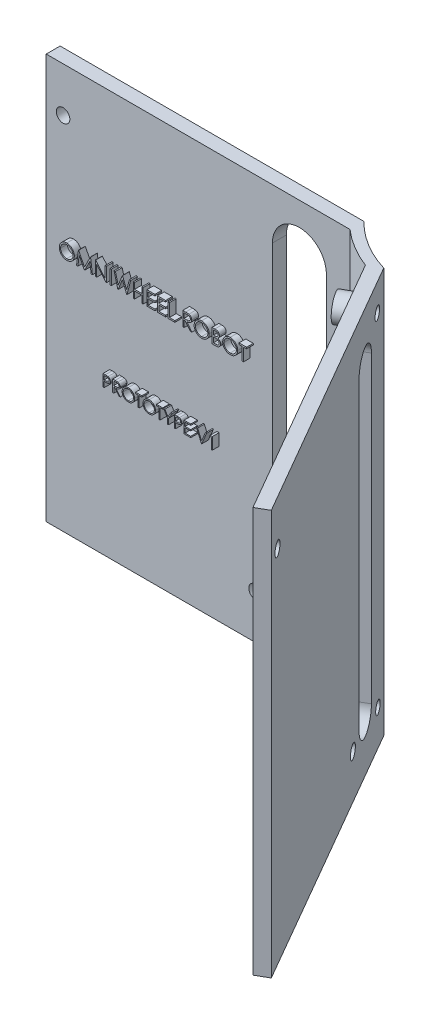
from build123d import *

# Parameters (mm, degrees)
BOSS_EXTRU_1_DEPTH      = 120
ENL_V_MAT_EXTRU_1_DEPTH = 188.009777727
ENL_V_MAT_EXTRU_2_DEPTH = 180.784310366
ESQUISSE6_R             = 2
ENL_V_MAT_EXTRU_3_DEPTH = 188.009777727
ESQUISSE7_R             = 2
ENL_V_MAT_EXTRU_4_DEPTH = 180.784310366
ESQUISSE8_W             = 0.379914529
ESQUISSE8_H             = 4.233333333
BOSS_EXTRU_2_DEPTH      = 2
ESQUISSE9_R             = 2
ENL_V_MAT_EXTRU_5_DEPTH = 188.009777853
ESQUISSE10_R            = 2
ENL_V_MAT_EXTRU_6_DEPTH = 180.784310483
ESQUISSE11_R            = 3.802776
ESQUISSE11_R_2          = 1.802776
BOSS_EXTRU_3_DEPTH      = 5
ENL_V_MAT_EXTRU_7_REACH = 181.784
ESQUISSE12_R            = 1.802776


with BuildPart() as part:
    # Esquisse3 → Boss.-Extru.1 (new body)
    with BuildSketch(Plane(origin=(0, 0, 0), x_dir=(1, 0, 0), z_dir=(0, 1, 0))):
        with BuildLine():
            ThreePointArc((-10.103808925, -33.509894736), (-18.121448463, -29.943498553), (-25, -24.494897428))
            Line((-25, -24.494897428), (-115, -24.494897428))
            Line((-115, -24.494897428), (-115, -28.618176043))
            Line((-115, -28.618176043), (-25, -28.618176043))
            ThreePointArc((-25, -28.618176043), (-19.581111, -32.566548666), (-13.552631037, -35.50107311))
            Line((-13.552631037, -35.50107311), (31.963111135, -114.336651096))
            Line((31.963111135, -114.336651096), (35.411933246, -112.345472721))
            Line((35.411933246, -112.345472721), (-10.103808925, -33.509894736))
        make_face()
    extrude(amount=BOSS_EXTRU_1_DEPTH)

    # Esquisse4 → Enlèv. mat.-Extru.1 (cut, through all)
    with BuildSketch(Plane.XY.offset(28.618176043)):
        with BuildLine():
            Line((-48, 105), (-48, 15))
            ThreePointArc((-48, 15), (-40, 7), (-32, 15))
            Line((-32, 15), (-32, 105))
            ThreePointArc((-32, 105), (-40, 113), (-48, 105))
        make_face()
    extrude(amount=-ENL_V_MAT_EXTRU_1_DEPTH, mode=Mode.SUBTRACT)

    # Esquisse5 → Enlèv. mat.-Extru.2 (cut, through all)
    with BuildSketch(Plane(origin=(-25.536888865, 0, 14.743729661), x_dir=(0.4999999999999999, 0, 0.8660254037844386), z_dir=(-0.8660254037844387, 0, 0.49999999999999994))):
        with BuildLine():
            Line((43.968515657, 105), (43.968515657, 15))
            ThreePointArc((43.968515657, 15), (38.968515657, 10), (33.968515657, 15))
            Line((33.968515657, 15), (33.968515657, 105))
            ThreePointArc((33.968515657, 105), (38.968515657, 110), (43.968515657, 105))
        make_face()
    extrude(amount=-ENL_V_MAT_EXTRU_2_DEPTH, mode=Mode.SUBTRACT)

    # Esquisse6 → Enlèv. mat.-Extru.3 (cut, through all)
    with BuildSketch(Plane.XY.offset(28.618176043)):
        with Locations((-110, 106.75)):
            Circle(ESQUISSE6_R)
    extrude(amount=-ENL_V_MAT_EXTRU_3_DEPTH, mode=Mode.SUBTRACT)

    # Esquisse7 → Enlèv. mat.-Extru.4 (cut, through all)
    with BuildSketch(Plane(origin=(-25.536888865, 0, 14.743729661), x_dir=(0.4999999999999999, 0, 0.8660254037844386), z_dir=(-0.8660254037844387, 0, 0.49999999999999994))):
        with Locations((110, 106.75)):
            Circle(ESQUISSE7_R)
    extrude(amount=-ENL_V_MAT_EXTRU_4_DEPTH, mode=Mode.SUBTRACT)

    # Esquisse8 → Boss.-Extru.2 (add)
    # profile 1 of 25: a face of its own
    with BuildSketch(Plane.XY.offset(28.618176043)):
        with BuildLine():
            add(Edge.make_bspline(
                [(-106.927136752, 76.562203816), (-106.848749805, 76.560218407), (-106.694791374, 76.556318902), (-106.468519831, 76.526468938), (-106.252504811, 76.474827848), (-106.044986643, 76.406050716), (-105.848447519, 76.314303031), (-105.661408096, 76.203407661), (-105.484313401, 76.072202802), (-105.319550397, 75.921702689), (-105.168774848, 75.757953178), (-105.035937823, 75.583203706), (-104.924610477, 75.398510869), (-104.833187668, 75.204429674), (-104.761464588, 75.001399046), (-104.71197203, 74.788336585), (-104.680357315, 74.566622779), (-104.67666128, 74.41539981), (-104.674786325, 74.338686188)],
                knots=[0, 0, 0, 0, 1.065120563, 2.091984664, 3.0946048, 4.079830382, 5.057816894, 6.036188127, 7.030412546, 8.04752943, 9.064399622, 10.05169764, 11.02544977, 11.989514704, 12.962713494, 13.945757189, 14.957906945, 16, 16, 16, 16], degree=3))
            add(Edge.make_bspline(
                [(-104.674786325, 74.338686188), (-104.676661005, 74.262537657), (-104.680356217, 74.112440082), (-104.712007977, 73.89213325), (-104.761648043, 73.680356883), (-104.832521622, 73.477464522), (-104.92350863, 73.283242136), (-105.035577265, 73.098200773), (-105.167586158, 72.92227977), (-105.317817302, 72.757406356), (-105.481588086, 72.606218939), (-105.657247552, 72.474478965), (-105.840845186, 72.361117405), (-106.034743595, 72.270664771), (-106.236371259, 72.19836921), (-106.447532735, 72.149077934), (-106.667238567, 72.117283129), (-106.817063496, 72.113632162), (-106.893215812, 72.111776465)],
                knots=[0, 0, 0, 0, 1.043624062, 2.057103931, 3.04512605, 4.022047818, 4.998200453, 5.980619268, 6.982898556, 8.009068085, 9.034988726, 10.034168286, 11.015286542, 11.987931943, 12.962482838, 13.94673481, 14.956375938, 16, 16, 16, 16], degree=3))
            add(Edge.make_bspline(
                [(-106.893215812, 72.111776465), (-106.969929036, 72.113650486), (-107.121151221, 72.117344679), (-107.343143635, 72.149011711), (-107.556355763, 72.198531193), (-107.760177883, 72.269299749), (-107.954723655, 72.36076059), (-108.140373565, 72.472283982), (-108.316382438, 72.604614524), (-108.481291027, 72.754796952), (-108.632178152, 72.918290163), (-108.763725207, 73.093470643), (-108.875273677, 73.276901528), (-108.966427422, 73.469091867), (-109.038593006, 73.669112564), (-109.087826453, 73.878297866), (-109.119680414, 74.095455173), (-109.123351133, 74.243310869), (-109.125213675, 74.318333624)],
                knots=[0, 0, 0, 0, 1.053102029, 2.075944431, 3.073151272, 4.055350789, 5.033113405, 6.020478099, 7.024410459, 8.052272461, 9.079885166, 10.07527673, 11.055994387, 12.023226415, 12.992069828, 13.970394897, 14.97016774, 16, 16, 16, 16], degree=3))
            add(Edge.make_bspline(
                [(-109.125213675, 74.318333624), (-109.124567021, 74.368689328), (-109.12328187, 74.468765478), (-109.107810013, 74.617375556), (-109.085359194, 74.763595685), (-109.053183547, 74.907010069), (-109.011102198, 75.047267641), (-108.961448793, 75.185335707), (-108.900803456, 75.319815068), (-108.832246863, 75.451342789), (-108.7557302, 75.577868542), (-108.671213817, 75.697465752), (-108.581666276, 75.811138006), (-108.483497219, 75.91593962), (-108.37994209, 76.014919375), (-108.269321004, 76.106556186), (-108.152308956, 76.191676364), (-108.028402459, 76.268384777), (-107.900654641, 76.337762016), (-107.768965586, 76.397297017), (-107.635123828, 76.448394634), (-107.498502492, 76.489809727), (-107.359464377, 76.522505618), (-107.217706028, 76.544769751), (-107.073340379, 76.560281069), (-106.976080974, 76.561560143), (-106.927136752, 76.562203816)],
                knots=[0, 0, 0, 0, 1.037015668, 2.060948919, 3.074880161, 4.083647147, 5.086022904, 6.090072063, 7.104153813, 8.122640571, 9.144368836, 10.147691507, 11.138137339, 12.123020368, 13.103399296, 14.087645067, 15.080126199, 16.082011238, 17.087798457, 18.072939717, 19.057185487, 20.037253025, 21.01195951, 21.997135196, 22.992090687, 24, 24, 24, 24], degree=3))
        make_face()
        with BuildLine():
            add(Edge.make_bspline(
                [(-106.908480235, 76.128015782), (-106.948654125, 76.127526057), (-107.02861784, 76.12655129), (-107.147495327, 76.11371133), (-107.26480938, 76.095411369), (-107.380584228, 76.069308005), (-107.494335454, 76.033743103), (-107.607123357, 75.992811719), (-107.717919432, 75.942953829), (-107.826357907, 75.886623034), (-107.93148376, 75.824273387), (-108.030680075, 75.755364678), (-108.124203654, 75.681512903), (-108.21182551, 75.602545709), (-108.293288356, 75.518060953), (-108.370195567, 75.429339435), (-108.439464489, 75.333845243), (-108.502947044, 75.234167894), (-108.559755765, 75.130437219), (-108.610271956, 75.02374529), (-108.651594138, 74.913221803), (-108.685294346, 74.800065822), (-108.713234117, 74.684456561), (-108.730934197, 74.56551701), (-108.743915241, 74.443844827), (-108.744834292, 74.361619156), (-108.745299145, 74.320029671)],
                knots=[0, 0, 0, 0, 1.008559885, 2.007477868, 2.99961109, 3.989939068, 4.984837346, 5.991145699, 7.001802488, 8.033829008, 9.059044045, 10.069351652, 11.065060232, 12.050310815, 13.029377138, 14.011219647, 14.996725999, 15.989392538, 16.977580475, 17.965360261, 18.951710183, 19.937753436, 20.929683414, 21.935841486, 22.955955122, 24, 24, 24, 24], degree=3))
            add(Edge.make_bspline(
                [(-108.745299145, 74.320029671), (-108.743757169, 74.258873461), (-108.740723626, 74.138560276), (-108.714165422, 73.962250236), (-108.673256939, 73.792810118), (-108.612953267, 73.631167047), (-108.537538714, 73.475931581), (-108.444372856, 73.328480826), (-108.333992819, 73.18877493), (-108.208609316, 73.057789224), (-108.071542804, 72.93823287), (-107.925997502, 72.833290461), (-107.773532662, 72.744499016), (-107.613750693, 72.672163357), (-107.447504622, 72.614844341), (-107.273723203, 72.575560664), (-107.093564076, 72.549706541), (-106.970760331, 72.547223684), (-106.908480235, 72.5459645)],
                knots=[0, 0, 0, 0, 1.032063989, 2.030389145, 3.003944642, 3.970395727, 4.937377036, 5.913328081, 6.909231446, 7.93887556, 8.970685674, 9.976071282, 10.964166581, 11.944589148, 12.933237628, 13.927779006, 14.949070134, 16, 16, 16, 16], degree=3))
            add(Edge.make_bspline(
                [(-106.908480235, 72.5459645), (-106.866619219, 72.546539633), (-106.783596251, 72.547680297), (-106.660109286, 72.559169172), (-106.538847011, 72.577592481), (-106.41997951, 72.604118131), (-106.303641691, 72.637316181), (-106.189347977, 72.676756004), (-106.078315759, 72.725960889), (-105.969144336, 72.780326506), (-105.864646025, 72.842302697), (-105.764889905, 72.908872649), (-105.672390386, 72.982615648), (-105.584834081, 73.060409573), (-105.503036781, 73.143822989), (-105.427551628, 73.232747448), (-105.358632802, 73.327744243), (-105.295174353, 73.427270401), (-105.238564692, 73.531284916), (-105.189241401, 73.638363669), (-105.147396575, 73.748242992), (-105.113616384, 73.861081369), (-105.087145397, 73.976664491), (-105.068905875, 74.095147118), (-105.056147287, 74.216292228), (-105.055185622, 74.298230035), (-105.054700855, 74.339534211)],
                knots=[0, 0, 0, 0, 1.047197238, 2.076906641, 3.100256066, 4.114471768, 5.12198147, 6.126382909, 7.136867548, 8.15857795, 9.17633901, 10.174870724, 11.156907918, 12.133735059, 13.104061851, 14.077631395, 15.04955518, 16.038496417, 17.029181396, 18.010275684, 18.986308667, 19.968651475, 20.955262928, 21.950658345, 22.966943676, 24, 24, 24, 24], degree=3))
            add(Edge.make_bspline(
                [(-105.054700855, 74.339534211), (-105.05518601, 74.380555821), (-105.056148406, 74.461929741), (-105.06889978, 74.582229969), (-105.087164667, 74.699860044), (-105.11348718, 74.814358167), (-105.147414509, 74.925753526), (-105.189248709, 75.033941497), (-105.238579499, 75.139325124), (-105.295195161, 75.24164394), (-105.358835252, 75.339826718), (-105.428375909, 75.433688684), (-105.505017806, 75.521467142), (-105.586571188, 75.605329106), (-105.675073116, 75.683485982), (-105.770122691, 75.755963697), (-105.870565997, 75.824511372), (-105.976916081, 75.886348956), (-106.086673054, 75.943455695), (-106.199296603, 75.992382146), (-106.313510847, 76.033956043), (-106.429025345, 76.06941561), (-106.546812376, 76.095309132), (-106.666076055, 76.113727821), (-106.786651377, 76.126546821), (-106.867741748, 76.127524574), (-106.908480235, 76.128015782)],
                knots=[0, 0, 0, 0, 1.02996197, 2.043119294, 3.035359645, 4.018872909, 4.991431989, 5.957985074, 6.929999688, 7.912076566, 8.892894881, 9.867085534, 10.843653904, 11.817741046, 12.803660682, 13.806313499, 14.818574707, 15.856120519, 16.894564902, 17.924820532, 18.937903209, 19.946497019, 20.957711757, 21.963978472, 22.977135795, 24, 24, 24, 24], degree=3))
        make_face(mode=Mode.SUBTRACT)
    # profile 2 of 25: a face of its own
    with BuildSketch(Plane.XY.offset(28.618176043)):
        Polygon((-104.023504274, 72.220323474), (-103.464656784, 76.453656807), (-103.41038328, 76.453656807), (-101.662606838, 72.980152534), (-99.919070513, 76.453656807), (-99.863948985, 76.453656807), (-99.301709402, 72.220323474), (-99.683319979, 72.220323474), (-100.088675214, 75.266423901), (-101.616813568, 72.220323474), (-101.702463942, 72.220323474), (-103.236538462, 75.273208089), (-103.641045673, 72.220323474), align=None)
    # profile 3 of 25: a face of its own
    with BuildSketch(Plane.XY.offset(28.618176043)):
        Polygon((-98.433333333, 72.220323474), (-98.433333333, 76.453656807), (-98.353619124, 76.453656807), (-95.556837607, 73.121772459), (-95.556837607, 76.453656807), (-95.176923077, 76.453656807), (-95.176923077, 72.220323474), (-95.263421474, 72.220323474), (-98.053418803, 75.544575611), (-98.053418803, 72.220323474), align=None)
    # profile 4 of 25: a face of its own
    with BuildSketch(Plane.XY.offset(28.618176043)):
        with Locations((-93.901495727, 74.336990141)):
            Rectangle(ESQUISSE8_W, ESQUISSE8_H)
    # profile 5 of 25: a face of its own
    with BuildSketch(Plane.XY.offset(28.618176043)):
        Polygon((-92.897435897, 76.453656807), (-92.504801015, 76.453656807), (-91.676282051, 73.349042758), (-90.4441039, 76.453656807), (-90.388982372, 76.453656807), (-89.179700855, 73.370243346), (-88.346941774, 76.453656807), (-87.958547009, 76.453656807), (-89.099986645, 72.220323474), (-89.15426015, 72.220323474), (-90.427991453, 75.458077213), (-91.716987179, 72.220323474), (-91.771260684, 72.220323474), align=None)
    # profile 6 of 25: a face of its own
    with BuildSketch(Plane.XY.offset(28.618176043)):
        Polygon((-87.198717949, 76.453656807), (-86.818803419, 76.453656807), (-86.818803419, 74.716904671), (-84.647863248, 74.716904671), (-84.647863248, 76.453656807), (-84.267948718, 76.453656807), (-84.267948718, 72.220323474), (-84.647863248, 72.220323474), (-84.647863248, 74.282716636), (-86.818803419, 74.282716636), (-86.818803419, 72.220323474), (-87.198717949, 72.220323474), align=None)
    # profile 7 of 25: a face of its own
    with BuildSketch(Plane.XY.offset(28.618176043)):
        Polygon((-83.182478632, 76.453656807), (-80.794444444, 76.453656807), (-80.794444444, 76.019468773), (-82.802564103, 76.019468773), (-82.802564103, 74.716904671), (-80.794444444, 74.716904671), (-80.794444444, 74.282716636), (-82.802564103, 74.282716636), (-82.802564103, 72.654511508), (-80.794444444, 72.654511508), (-80.794444444, 72.220323474), (-83.182478632, 72.220323474), align=None)
    # profile 8 of 25: a face of its own
    with BuildSketch(Plane.XY.offset(28.618176043)):
        Polygon((-80.034615385, 76.453656807), (-77.646581197, 76.453656807), (-77.646581197, 76.019468773), (-79.654700855, 76.019468773), (-79.654700855, 74.716904671), (-77.646581197, 74.716904671), (-77.646581197, 74.282716636), (-79.654700855, 74.282716636), (-79.654700855, 72.654511508), (-77.646581197, 72.654511508), (-77.646581197, 72.220323474), (-80.034615385, 72.220323474), align=None)
    # profile 9 of 25: a face of its own
    with BuildSketch(Plane.XY.offset(28.618176043)):
        Polygon((-76.886752137, 76.453656807), (-76.506837607, 76.453656807), (-76.506837607, 72.654511508), (-74.878632479, 72.654511508), (-74.878632479, 72.220323474), (-76.886752137, 72.220323474), align=None)
    # profile 10 of 25: a face of its own
    with BuildSketch(Plane.XY.offset(28.618176043)):
        with BuildLine():
            Line((-72.544871795, 76.453656807), (-71.697696314, 76.453656807))
            add(Edge.make_bspline(
                [(-71.697696314, 76.453656807), (-71.641161806, 76.453468622), (-71.532609289, 76.453107286), (-71.377096857, 76.451092506), (-71.235791702, 76.44531781), (-71.108767705, 76.44034838), (-70.996027199, 76.431286699), (-70.897224476, 76.422625725), (-70.812814594, 76.41128806), (-70.761717231, 76.400758643), (-70.738581731, 76.395991209)],
                knots=[0, 0, 0, 0, 1.410062039, 2.707475311, 3.878576406, 4.937260626, 5.877586885, 6.699081471, 7.410979367, 8, 8, 8, 8], degree=3))
            add(Edge.make_bspline(
                [(-70.738581731, 76.395991209), (-70.707609909, 76.388338836), (-70.646326979, 76.373197335), (-70.558092137, 76.341193818), (-70.474012907, 76.304158653), (-70.394438548, 76.260659677), (-70.319767639, 76.210373991), (-70.249230254, 76.15416969), (-70.182506312, 76.092354308), (-70.122294245, 76.023369309), (-70.065520345, 75.950995626), (-70.017636958, 75.872734892), (-69.976360169, 75.790896663), (-69.943496781, 75.704648644), (-69.917034851, 75.614827262), (-69.898376448, 75.520618908), (-69.887186916, 75.422452776), (-69.886047719, 75.355496068), (-69.885470085, 75.321545429)],
                knots=[0, 0, 0, 0, 1.027469482, 2.033020251, 3.019912614, 3.986113645, 4.951240523, 5.91722682, 6.890402269, 7.87763091, 8.8651537, 9.85103654, 10.82876324, 11.815024772, 12.821070561, 13.842952187, 14.906261191, 16, 16, 16, 16], degree=3))
            add(Edge.make_bspline(
                [(-69.885470085, 75.321545429), (-69.887246874, 75.26513916), (-69.890713848, 75.155075919), (-69.923038497, 74.995345138), (-69.97598724, 74.846344729), (-70.048949694, 74.7082623), (-70.141864679, 74.583789425), (-70.253533712, 74.474460017), (-70.38401909, 74.382971741), (-70.505490739, 74.319528825), (-70.612792675, 74.278897402), (-70.701128206, 74.250308664), (-70.797487312, 74.228220382), (-70.900946755, 74.208432413), (-71.011937081, 74.193492744), (-71.130192272, 74.182550673), (-71.255796665, 74.175711967), (-71.342082967, 74.174693542), (-71.386471688, 74.174169628)],
                knots=[0, 0, 0, 0, 1.260483769, 2.459530307, 3.627416485, 4.787058657, 5.939039949, 7.08810263, 8.267026773, 9.491475466, 10.141966685, 10.831826277, 11.566392101, 12.351337768, 13.187381173, 14.07005841, 15.007169909, 16, 16, 16, 16], degree=3))
            Line((-71.386471688, 74.174169628), (-69.831196581, 72.220323474))
            Line((-69.831196581, 72.220323474), (-70.301001603, 72.220323474))
            Line((-70.301001603, 72.220323474), (-71.856276709, 74.174169628))
            Line((-71.856276709, 74.174169628), (-72.164957265, 74.174169628))
            Line((-72.164957265, 74.174169628), (-72.164957265, 72.220323474))
            Line((-72.164957265, 72.220323474), (-72.544871795, 72.220323474))
            Line((-72.544871795, 72.220323474), (-72.544871795, 76.453656807))
        make_face()
        with BuildLine():
            Line((-72.164957265, 76.019468773), (-72.164957265, 74.608357662))
            Line((-72.164957265, 74.608357662), (-71.389863782, 74.602421497))
            add(Edge.make_bspline(
                [(-71.389863782, 74.602421497), (-71.353674783, 74.602405487), (-71.283530194, 74.602374455), (-71.182050343, 74.607205023), (-71.087562208, 74.612700274), (-71.000427203, 74.621105673), (-70.920606402, 74.631938255), (-70.848139702, 74.645488531), (-70.782908811, 74.661275312), (-70.706831531, 74.685709659), (-70.621878774, 74.724421701), (-70.529554056, 74.78074378), (-70.450932181, 74.851584524), (-70.384507719, 74.932590514), (-70.331132121, 75.02165531), (-70.29350135, 75.117711299), (-70.269622396, 75.218333518), (-70.266805965, 75.287491801), (-70.265384615, 75.322393453)],
                knots=[0, 0, 0, 0, 1.146690395, 2.22261258, 3.21895312, 4.145990853, 4.996080663, 5.770904154, 6.481378293, 7.121626537, 8.300444488, 9.431385265, 10.535395872, 11.636531494, 12.74115979, 13.810798291, 14.895190096, 16, 16, 16, 16], degree=3))
            add(Edge.make_bspline(
                [(-70.265384615, 75.322393453), (-70.266838609, 75.356437404), (-70.269719895, 75.423900092), (-70.293243644, 75.52266486), (-70.333024134, 75.615879171), (-70.386632936, 75.703163834), (-70.451946199, 75.782394581), (-70.528530601, 75.850184947), (-70.614292123, 75.906124776), (-70.694448715, 75.941871503), (-70.766093906, 75.963787897), (-70.828299304, 75.979210733), (-70.89858652, 75.991601662), (-70.977296837, 76.001529507), (-71.064094238, 76.01006263), (-71.159417597, 76.01581002), (-71.262634464, 76.019213455), (-71.334174086, 76.019381687), (-71.371207265, 76.019468773)],
                knots=[0, 0, 0, 0, 1.101028733, 2.181837193, 3.264309656, 4.369019818, 5.486613113, 6.575447106, 7.666700264, 8.788928104, 9.402425223, 10.0903467, 10.862060571, 11.710948788, 12.657782767, 13.684531032, 14.801375019, 16, 16, 16, 16], degree=3))
            Line((-71.371207265, 76.019468773), (-72.164957265, 76.019468773))
        make_face(mode=Mode.SUBTRACT)
    # profile 11 of 25: a face of its own
    with BuildSketch(Plane.XY.offset(28.618176043)):
        with BuildLine():
            add(Edge.make_bspline(
                [(-66.981837607, 76.562203816), (-66.90345066, 76.560218407), (-66.749492228, 76.556318902), (-66.523220685, 76.526468938), (-66.307205665, 76.474827848), (-66.099687497, 76.406050716), (-65.903148373, 76.314303031), (-65.716108951, 76.203407661), (-65.539014256, 76.072202802), (-65.374251252, 75.921702689), (-65.223475702, 75.757953178), (-65.090638678, 75.583203706), (-64.979311332, 75.398510869), (-64.887888523, 75.204429674), (-64.816165443, 75.001399046), (-64.766672885, 74.788336585), (-64.73505817, 74.566622779), (-64.731362135, 74.41539981), (-64.729487179, 74.338686188)],
                knots=[0, 0, 0, 0, 1.065120563, 2.091984664, 3.0946048, 4.079830382, 5.057816894, 6.036188127, 7.030412546, 8.04752943, 9.064399622, 10.05169764, 11.02544977, 11.989514704, 12.962713494, 13.945757189, 14.957906945, 16, 16, 16, 16], degree=3))
            add(Edge.make_bspline(
                [(-64.729487179, 74.338686188), (-64.73136186, 74.262537657), (-64.735057072, 74.112440082), (-64.766708831, 73.89213325), (-64.816348898, 73.680356883), (-64.887222477, 73.477464522), (-64.978209484, 73.283242136), (-65.09027812, 73.098200773), (-65.222287013, 72.92227977), (-65.372518157, 72.757406356), (-65.536288941, 72.606218939), (-65.711948406, 72.474478965), (-65.895546041, 72.361117405), (-66.08944445, 72.270664771), (-66.291072113, 72.19836921), (-66.50223359, 72.149077934), (-66.721939422, 72.117283129), (-66.87176435, 72.113632162), (-66.947916667, 72.111776465)],
                knots=[0, 0, 0, 0, 1.043624062, 2.057103931, 3.04512605, 4.022047818, 4.998200453, 5.980619268, 6.982898556, 8.009068085, 9.034988726, 10.034168286, 11.015286542, 11.987931943, 12.962482838, 13.94673481, 14.956375938, 16, 16, 16, 16], degree=3))
            add(Edge.make_bspline(
                [(-66.947916667, 72.111776465), (-67.024629891, 72.113650486), (-67.175852076, 72.117344679), (-67.39784449, 72.149011711), (-67.611056618, 72.198531193), (-67.814878738, 72.269299749), (-68.00942451, 72.36076059), (-68.19507442, 72.472283982), (-68.371083293, 72.604614524), (-68.535991882, 72.754796952), (-68.686879007, 72.918290163), (-68.818426061, 73.093470643), (-68.929974532, 73.276901528), (-69.021128277, 73.469091867), (-69.093293861, 73.669112564), (-69.142527308, 73.878297866), (-69.174381269, 74.095455173), (-69.178051988, 74.243310869), (-69.17991453, 74.318333624)],
                knots=[0, 0, 0, 0, 1.053102029, 2.075944431, 3.073151272, 4.055350789, 5.033113405, 6.020478099, 7.024410459, 8.052272461, 9.079885166, 10.07527673, 11.055994387, 12.023226415, 12.992069828, 13.970394897, 14.97016774, 16, 16, 16, 16], degree=3))
            add(Edge.make_bspline(
                [(-69.17991453, 74.318333624), (-69.179267876, 74.368689328), (-69.177982725, 74.468765478), (-69.162510868, 74.617375556), (-69.140060048, 74.763595685), (-69.107884402, 74.907010069), (-69.065803052, 75.047267641), (-69.016149648, 75.185335707), (-68.955504311, 75.319815068), (-68.886947718, 75.451342789), (-68.810431055, 75.577868542), (-68.725914672, 75.697465752), (-68.636367131, 75.811138006), (-68.538198074, 75.91593962), (-68.434642945, 76.014919375), (-68.324021859, 76.106556186), (-68.207009811, 76.191676364), (-68.083103314, 76.268384777), (-67.955355495, 76.337762016), (-67.82366644, 76.397297017), (-67.689824683, 76.448394634), (-67.553203346, 76.489809727), (-67.414165232, 76.522505618), (-67.272406883, 76.544769751), (-67.128041234, 76.560281069), (-67.030781829, 76.561560143), (-66.981837607, 76.562203816)],
                knots=[0, 0, 0, 0, 1.037015668, 2.060948919, 3.074880161, 4.083647147, 5.086022904, 6.090072063, 7.104153813, 8.122640571, 9.144368836, 10.147691507, 11.138137339, 12.123020368, 13.103399296, 14.087645067, 15.080126199, 16.082011238, 17.087798457, 18.072939717, 19.057185487, 20.037253025, 21.01195951, 21.997135196, 22.992090687, 24, 24, 24, 24], degree=3))
        make_face()
        with BuildLine():
            add(Edge.make_bspline(
                [(-66.96318109, 76.128015782), (-67.00335498, 76.127526057), (-67.083318695, 76.12655129), (-67.202196182, 76.11371133), (-67.319510235, 76.095411369), (-67.435285082, 76.069308005), (-67.549036309, 76.033743103), (-67.661824212, 75.992811719), (-67.772620287, 75.942953829), (-67.881058762, 75.886623034), (-67.986184615, 75.824273387), (-68.08538093, 75.755364678), (-68.178904509, 75.681512903), (-68.266526365, 75.602545709), (-68.347989211, 75.518060953), (-68.424896422, 75.429339435), (-68.494165344, 75.333845243), (-68.557647899, 75.234167894), (-68.61445662, 75.130437219), (-68.664972811, 75.02374529), (-68.706294993, 74.913221803), (-68.739995201, 74.800065822), (-68.767934972, 74.684456561), (-68.785635051, 74.56551701), (-68.798616096, 74.443844827), (-68.799535147, 74.361619156), (-68.8, 74.320029671)],
                knots=[0, 0, 0, 0, 1.008559885, 2.007477868, 2.99961109, 3.989939068, 4.984837346, 5.991145699, 7.001802488, 8.033829008, 9.059044045, 10.069351652, 11.065060232, 12.050310815, 13.029377138, 14.011219647, 14.996725999, 15.989392538, 16.977580475, 17.965360261, 18.951710183, 19.937753436, 20.929683414, 21.935841486, 22.955955122, 24, 24, 24, 24], degree=3))
            add(Edge.make_bspline(
                [(-68.8, 74.320029671), (-68.798458024, 74.258873461), (-68.795424481, 74.138560276), (-68.768866277, 73.962250236), (-68.727957793, 73.792810118), (-68.667654121, 73.631167047), (-68.592239569, 73.475931581), (-68.499073711, 73.328480826), (-68.388693674, 73.18877493), (-68.26331017, 73.057789224), (-68.126243659, 72.93823287), (-67.980698357, 72.833290461), (-67.828233517, 72.744499016), (-67.668451548, 72.672163357), (-67.502205477, 72.614844341), (-67.328424058, 72.575560664), (-67.148264931, 72.549706541), (-67.025461186, 72.547223684), (-66.96318109, 72.5459645)],
                knots=[0, 0, 0, 0, 1.032063989, 2.030389145, 3.003944642, 3.970395727, 4.937377036, 5.913328081, 6.909231446, 7.93887556, 8.970685674, 9.976071282, 10.964166581, 11.944589148, 12.933237628, 13.927779006, 14.949070134, 16, 16, 16, 16], degree=3))
            add(Edge.make_bspline(
                [(-66.96318109, 72.5459645), (-66.921320074, 72.546539633), (-66.838297106, 72.547680297), (-66.714810141, 72.559169172), (-66.593547865, 72.577592481), (-66.474680365, 72.604118131), (-66.358342546, 72.637316181), (-66.244048831, 72.676756004), (-66.133016613, 72.725960889), (-66.023845191, 72.780326506), (-65.919346879, 72.842302697), (-65.819590759, 72.908872649), (-65.727091241, 72.982615648), (-65.639534935, 73.060409573), (-65.557737635, 73.143822989), (-65.482252483, 73.232747448), (-65.413333656, 73.327744243), (-65.349875208, 73.427270401), (-65.293265547, 73.531284916), (-65.243942256, 73.638363669), (-65.20209743, 73.748242992), (-65.168317238, 73.861081369), (-65.141846251, 73.976664491), (-65.123606729, 74.095147118), (-65.110848142, 74.216292228), (-65.109886477, 74.298230035), (-65.109401709, 74.339534211)],
                knots=[0, 0, 0, 0, 1.047197238, 2.076906641, 3.100256066, 4.114471768, 5.12198147, 6.126382909, 7.136867548, 8.15857795, 9.17633901, 10.174870724, 11.156907918, 12.133735059, 13.104061851, 14.077631395, 15.04955518, 16.038496417, 17.029181396, 18.010275684, 18.986308667, 19.968651475, 20.955262928, 21.950658345, 22.966943676, 24, 24, 24, 24], degree=3))
            add(Edge.make_bspline(
                [(-65.109401709, 74.339534211), (-65.109886865, 74.380555821), (-65.110849261, 74.461929741), (-65.123600635, 74.582229969), (-65.141865521, 74.699860044), (-65.168188035, 74.814358167), (-65.202115364, 74.925753526), (-65.243949563, 75.033941497), (-65.293280354, 75.139325124), (-65.349896016, 75.24164394), (-65.413536107, 75.339826718), (-65.483076763, 75.433688684), (-65.559718661, 75.521467142), (-65.641272043, 75.605329106), (-65.729773971, 75.683485982), (-65.824823546, 75.755963697), (-65.925266851, 75.824511372), (-66.031616936, 75.886348956), (-66.141373909, 75.943455695), (-66.253997458, 75.992382146), (-66.368211702, 76.033956043), (-66.4837262, 76.06941561), (-66.601513231, 76.095309132), (-66.72077691, 76.113727821), (-66.841352232, 76.126546821), (-66.922442602, 76.127524574), (-66.96318109, 76.128015782)],
                knots=[0, 0, 0, 0, 1.02996197, 2.043119294, 3.035359645, 4.018872909, 4.991431989, 5.957985074, 6.929999688, 7.912076566, 8.892894881, 9.867085534, 10.843653904, 11.817741046, 12.803660682, 13.806313499, 14.818574707, 15.856120519, 16.894564902, 17.924820532, 18.937903209, 19.946497019, 20.957711757, 21.963978472, 22.977135795, 24, 24, 24, 24], degree=3))
        make_face(mode=Mode.SUBTRACT)
    # profile 12 of 25: a face of its own
    with BuildSketch(Plane.XY.offset(28.618176043)):
        with BuildLine():
            Line((-63.861111111, 76.453656807), (-63.035136218, 76.453656807))
            add(Edge.make_bspline(
                [(-63.035136218, 76.453656807), (-62.994703678, 76.453444233), (-62.916335352, 76.453032211), (-62.802374694, 76.446642138), (-62.695635656, 76.437929128), (-62.596087284, 76.424104159), (-62.503775577, 76.407422676), (-62.41842234, 76.387221432), (-62.340298988, 76.362998766), (-62.247029298, 76.32447993), (-62.140687165, 76.267241431), (-62.025542442, 76.182661167), (-61.927082077, 76.079207616), (-61.842190055, 75.962509547), (-61.774697272, 75.834135804), (-61.725869646, 75.697146119), (-61.694956787, 75.553307441), (-61.691777633, 75.454558073), (-61.69017094, 75.404651733)],
                knots=[0, 0, 0, 0, 1.001505555, 1.941167018, 2.826882275, 3.653841531, 4.429895133, 5.150066043, 5.825578002, 6.45369114, 7.647487171, 8.808567382, 9.977351308, 11.170798116, 12.373658725, 13.556498008, 14.765093433, 16, 16, 16, 16], degree=3))
            add(Edge.make_bspline(
                [(-61.69017094, 75.404651733), (-61.691493214, 75.357900546), (-61.694091606, 75.266030056), (-61.718938563, 75.131659086), (-61.757837657, 75.003750469), (-61.811909721, 74.882771012), (-61.882185468, 74.771454166), (-61.965471244, 74.668901949), (-62.065954615, 74.579456384), (-62.141239296, 74.529451159), (-62.179480502, 74.504050771)],
                knots=[0, 0, 0, 0, 1.044552857, 2.05264487, 3.044412934, 4.028983338, 5.005914585, 5.980388656, 6.974128949, 8, 8, 8, 8], degree=3))
            add(Edge.make_bspline(
                [(-62.179480502, 74.504050771), (-62.131389318, 74.485587391), (-62.039378971, 74.450262372), (-61.912758746, 74.387808049), (-61.803665933, 74.319878639), (-61.711261766, 74.245696306), (-61.632234317, 74.165736126), (-61.563227426, 74.078825654), (-61.504346145, 73.983831157), (-61.453893371, 73.881743071), (-61.414524875, 73.773603819), (-61.385041638, 73.660427737), (-61.368147676, 73.542620656), (-61.365743577, 73.462446912), (-61.364529915, 73.42197278)],
                knots=[0, 0, 0, 0, 1.27268992, 2.434971085, 3.483601985, 4.442670788, 5.356604649, 6.2567628, 7.179492994, 8.113709626, 9.066344395, 10.018646069, 10.999752585, 12, 12, 12, 12], degree=3))
            add(Edge.make_bspline(
                [(-61.364529915, 73.42197278), (-61.365711433, 73.380647134), (-61.368036104, 73.299337769), (-61.385187117, 73.179891083), (-61.414226704, 73.065742338), (-61.454227043, 72.956153212), (-61.50643289, 72.851335716), (-61.569966714, 72.751171101), (-61.645721081, 72.656665768), (-61.730463789, 72.566769577), (-61.826333241, 72.485939777), (-61.929766583, 72.413954112), (-62.042066418, 72.354752685), (-62.161388353, 72.305021878), (-62.289070907, 72.267034124), (-62.424540727, 72.240457772), (-62.567680978, 72.222550727), (-62.665906106, 72.221078489), (-62.71627938, 72.220323474)],
                knots=[0, 0, 0, 0, 0.978564426, 1.925352924, 2.850884081, 3.763762016, 4.682927383, 5.618979971, 6.567305752, 7.547517671, 8.540179244, 9.531824382, 10.526200242, 11.540722885, 12.589160233, 13.674978461, 14.80764778, 16, 16, 16, 16], degree=3))
            Line((-62.71627938, 72.220323474), (-63.861111111, 72.220323474))
            Line((-63.861111111, 72.220323474), (-63.861111111, 76.453656807))
        make_face()
        with BuildLine():
            Line((-63.481196581, 76.019468773), (-63.481196581, 74.662631166))
            Line((-63.481196581, 74.662631166), (-63.225941506, 74.662631166))
            add(Edge.make_bspline(
                [(-63.225941506, 74.662631166), (-63.188629154, 74.663114883), (-63.116534085, 74.664049521), (-63.012128115, 74.666726823), (-62.915214998, 74.674223504), (-62.825962019, 74.68171803), (-62.744509729, 74.693903484), (-62.671038583, 74.708408242), (-62.604395518, 74.723748518), (-62.527542925, 74.749837326), (-62.440368977, 74.788394133), (-62.347437508, 74.848231497), (-62.265511055, 74.919501905), (-62.196329694, 75.001738592), (-62.139710106, 75.092291026), (-62.100383994, 75.189714396), (-62.073717278, 75.291580651), (-62.071308474, 75.361513204), (-62.07008547, 75.397019521)],
                knots=[0, 0, 0, 0, 1.156816544, 2.235205308, 3.236616184, 4.169592532, 5.011045266, 5.787822928, 6.49130361, 7.128639758, 8.301311294, 9.436451833, 10.541879658, 11.654887649, 12.756523258, 13.837046038, 14.901820046, 16, 16, 16, 16], degree=3))
            add(Edge.make_bspline(
                [(-62.07008547, 75.397019521), (-62.070721898, 75.420515454), (-62.07197032, 75.466605293), (-62.08219479, 75.533793559), (-62.099572714, 75.596983622), (-62.121893621, 75.65704145), (-62.153085654, 75.712089117), (-62.189810986, 75.764029935), (-62.234183201, 75.811095068), (-62.284689665, 75.855084843), (-62.342757238, 75.894085367), (-62.408351276, 75.928243242), (-62.482359229, 75.955748753), (-62.563533825, 75.979837814), (-62.653124569, 75.996756988), (-62.7500976, 76.010852038), (-62.855247212, 76.018027831), (-62.927994146, 76.018977746), (-62.965598291, 76.019468773)],
                knots=[0, 0, 0, 0, 0.91205012, 1.789085906, 2.630437955, 3.453916878, 4.269457761, 5.079663411, 5.91843418, 6.774407191, 7.675494373, 8.627863946, 9.638891023, 10.736472738, 11.911756761, 13.175263542, 14.539845004, 16, 16, 16, 16], degree=3))
            Line((-62.965598291, 76.019468773), (-63.481196581, 76.019468773))
        make_face(mode=Mode.SUBTRACT)
        with BuildLine():
            Line((-63.481196581, 74.228443132), (-63.481196581, 72.654511508))
            Line((-63.481196581, 72.654511508), (-62.940157585, 72.654511508))
            add(Edge.make_bspline(
                [(-62.940157585, 72.654511508), (-62.901429932, 72.65497566), (-62.826787486, 72.655870251), (-62.719017427, 72.658790712), (-62.619131197, 72.66543375), (-62.527584594, 72.675891111), (-62.443389094, 72.687234569), (-62.36755473, 72.702488213), (-62.299466772, 72.719964575), (-62.220515943, 72.746978288), (-62.131611699, 72.788944496), (-62.035804283, 72.852219798), (-61.950622095, 72.927601323), (-61.87828621, 73.014845381), (-61.819003833, 73.109709938), (-61.775877711, 73.210276219), (-61.749279247, 73.314882523), (-61.746059289, 73.386204166), (-61.744444444, 73.42197278)],
                knots=[0, 0, 0, 0, 1.160039823, 2.235823828, 3.228722157, 4.157150951, 4.99529583, 5.772374946, 6.472645482, 7.099169577, 8.269452708, 9.405989375, 10.527446681, 11.663510218, 12.788923519, 13.866172445, 14.929861265, 16, 16, 16, 16], degree=3))
            add(Edge.make_bspline(
                [(-61.744444444, 73.42197278), (-61.744778399, 73.444340915), (-61.745440922, 73.488716386), (-61.755432332, 73.553928854), (-61.769963394, 73.617097291), (-61.788749033, 73.678393224), (-61.816107817, 73.736708451), (-61.848047162, 73.793196309), (-61.885495714, 73.84793147), (-61.943848182, 73.917131052), (-62.028722868, 73.996859249), (-62.149320587, 74.074918895), (-62.28644708, 74.137871956), (-62.385903191, 74.164601799), (-62.437279647, 74.178409745)],
                knots=[0, 0, 0, 0, 0.723448775, 1.435228256, 2.130040452, 2.821711965, 3.505591119, 4.210454504, 4.921174351, 5.648778258, 7.137944449, 8.670945889, 10.280296675, 12, 12, 12, 12], degree=3))
            add(Edge.make_bspline(
                [(-62.437279647, 74.178409745), (-62.457876744, 74.182588752), (-62.502535499, 74.191649699), (-62.575358001, 74.201214255), (-62.658495671, 74.209735423), (-62.752140484, 74.216038442), (-62.856410921, 74.222553594), (-62.97152967, 74.22508733), (-63.097026612, 74.228110245), (-63.184103101, 74.228329331), (-63.2293336, 74.228443132)],
                knots=[0, 0, 0, 0, 0.634451884, 1.375622551, 2.216452059, 3.157844607, 4.20941857, 5.370758133, 6.634282058, 8, 8, 8, 8], degree=3))
            Line((-63.2293336, 74.228443132), (-63.481196581, 74.228443132))
        make_face(mode=Mode.SUBTRACT)
    # profile 13 of 25: a face of its own
    with BuildSketch(Plane.XY.offset(28.618176043)):
        with BuildLine():
            add(Edge.make_bspline(
                [(-58.51517094, 76.562203816), (-58.436783993, 76.560218407), (-58.282825562, 76.556318902), (-58.056554019, 76.526468938), (-57.840538999, 76.474827848), (-57.633020831, 76.406050716), (-57.436481707, 76.314303031), (-57.249442284, 76.203407661), (-57.072347589, 76.072202802), (-56.907584585, 75.921702689), (-56.756809036, 75.757953178), (-56.623972011, 75.583203706), (-56.512644666, 75.398510869), (-56.421221856, 75.204429674), (-56.349498776, 75.001399046), (-56.300006218, 74.788336585), (-56.268391503, 74.566622779), (-56.264695468, 74.41539981), (-56.262820513, 74.338686188)],
                knots=[0, 0, 0, 0, 1.065120563, 2.091984664, 3.0946048, 4.079830382, 5.057816894, 6.036188127, 7.030412546, 8.04752943, 9.064399622, 10.05169764, 11.02544977, 11.989514704, 12.962713494, 13.945757189, 14.957906945, 16, 16, 16, 16], degree=3))
            add(Edge.make_bspline(
                [(-56.262820513, 74.338686188), (-56.264695193, 74.262537657), (-56.268390405, 74.112440082), (-56.300042165, 73.89213325), (-56.349682231, 73.680356883), (-56.42055581, 73.477464522), (-56.511542818, 73.283242136), (-56.623611453, 73.098200773), (-56.755620346, 72.92227977), (-56.90585149, 72.757406356), (-57.069622274, 72.606218939), (-57.24528174, 72.474478965), (-57.428879374, 72.361117405), (-57.622777783, 72.270664771), (-57.824405447, 72.19836921), (-58.035566923, 72.149077934), (-58.255272755, 72.117283129), (-58.405097684, 72.113632162), (-58.48125, 72.111776465)],
                knots=[0, 0, 0, 0, 1.043624062, 2.057103931, 3.04512605, 4.022047818, 4.998200453, 5.980619268, 6.982898556, 8.009068085, 9.034988726, 10.034168286, 11.015286542, 11.987931943, 12.962482838, 13.94673481, 14.956375938, 16, 16, 16, 16], degree=3))
            add(Edge.make_bspline(
                [(-58.48125, 72.111776465), (-58.557963224, 72.113650486), (-58.709185409, 72.117344679), (-58.931177823, 72.149011711), (-59.144389951, 72.198531193), (-59.348212071, 72.269299749), (-59.542757843, 72.36076059), (-59.728407753, 72.472283982), (-59.904416626, 72.604614524), (-60.069325215, 72.754796952), (-60.22021234, 72.918290163), (-60.351759395, 73.093470643), (-60.463307865, 73.276901528), (-60.55446161, 73.469091867), (-60.626627194, 73.669112564), (-60.675860641, 73.878297866), (-60.707714602, 74.095455173), (-60.711385321, 74.243310869), (-60.713247863, 74.318333624)],
                knots=[0, 0, 0, 0, 1.053102029, 2.075944431, 3.073151272, 4.055350789, 5.033113405, 6.020478099, 7.024410459, 8.052272461, 9.079885166, 10.07527673, 11.055994387, 12.023226415, 12.992069828, 13.970394897, 14.97016774, 16, 16, 16, 16], degree=3))
            add(Edge.make_bspline(
                [(-60.713247863, 74.318333624), (-60.712601209, 74.368689328), (-60.711316058, 74.468765478), (-60.695844201, 74.617375556), (-60.673393382, 74.763595685), (-60.641217735, 74.907010069), (-60.599136386, 75.047267641), (-60.549482981, 75.185335707), (-60.488837644, 75.319815068), (-60.420281051, 75.451342789), (-60.343764388, 75.577868542), (-60.259248005, 75.697465752), (-60.169700464, 75.811138006), (-60.071531407, 75.91593962), (-59.967976278, 76.014919375), (-59.857355192, 76.106556186), (-59.740343144, 76.191676364), (-59.616436647, 76.268384777), (-59.488688829, 76.337762016), (-59.356999774, 76.397297017), (-59.223158016, 76.448394634), (-59.08653668, 76.489809727), (-58.947498565, 76.522505618), (-58.805740216, 76.544769751), (-58.661374567, 76.560281069), (-58.564115162, 76.561560143), (-58.51517094, 76.562203816)],
                knots=[0, 0, 0, 0, 1.037015668, 2.060948919, 3.074880161, 4.083647147, 5.086022904, 6.090072063, 7.104153813, 8.122640571, 9.144368836, 10.147691507, 11.138137339, 12.123020368, 13.103399296, 14.087645067, 15.080126199, 16.082011238, 17.087798457, 18.072939717, 19.057185487, 20.037253025, 21.01195951, 21.997135196, 22.992090687, 24, 24, 24, 24], degree=3))
        make_face()
        with BuildLine():
            add(Edge.make_bspline(
                [(-58.496514423, 76.128015782), (-58.536688313, 76.127526057), (-58.616652028, 76.12655129), (-58.735529515, 76.11371133), (-58.852843568, 76.095411369), (-58.968618416, 76.069308005), (-59.082369642, 76.033743103), (-59.195157545, 75.992811719), (-59.30595362, 75.942953829), (-59.414392096, 75.886623034), (-59.519517948, 75.824273387), (-59.618714263, 75.755364678), (-59.712237842, 75.681512903), (-59.799859698, 75.602545709), (-59.881322545, 75.518060953), (-59.958229755, 75.429339435), (-60.027498677, 75.333845243), (-60.090981232, 75.234167894), (-60.147789953, 75.130437219), (-60.198306144, 75.02374529), (-60.239628326, 74.913221803), (-60.273328534, 74.800065822), (-60.301268305, 74.684456561), (-60.318968385, 74.56551701), (-60.331949429, 74.443844827), (-60.33286848, 74.361619156), (-60.333333333, 74.320029671)],
                knots=[0, 0, 0, 0, 1.008559885, 2.007477868, 2.99961109, 3.989939068, 4.984837346, 5.991145699, 7.001802488, 8.033829008, 9.059044045, 10.069351652, 11.065060232, 12.050310815, 13.029377138, 14.011219647, 14.996725999, 15.989392538, 16.977580475, 17.965360261, 18.951710183, 19.937753436, 20.929683414, 21.935841486, 22.955955122, 24, 24, 24, 24], degree=3))
            add(Edge.make_bspline(
                [(-60.333333333, 74.320029671), (-60.331791357, 74.258873461), (-60.328757814, 74.138560276), (-60.30219961, 73.962250236), (-60.261291127, 73.792810118), (-60.200987455, 73.631167047), (-60.125572902, 73.475931581), (-60.032407044, 73.328480826), (-59.922027007, 73.18877493), (-59.796643504, 73.057789224), (-59.659576992, 72.93823287), (-59.51403169, 72.833290461), (-59.36156685, 72.744499016), (-59.201784881, 72.672163357), (-59.03553881, 72.614844341), (-58.861757392, 72.575560664), (-58.681598264, 72.549706541), (-58.558794519, 72.547223684), (-58.496514423, 72.5459645)],
                knots=[0, 0, 0, 0, 1.032063989, 2.030389145, 3.003944642, 3.970395727, 4.937377036, 5.913328081, 6.909231446, 7.93887556, 8.970685674, 9.976071282, 10.964166581, 11.944589148, 12.933237628, 13.927779006, 14.949070134, 16, 16, 16, 16], degree=3))
            add(Edge.make_bspline(
                [(-58.496514423, 72.5459645), (-58.454653407, 72.546539633), (-58.371630439, 72.547680297), (-58.248143474, 72.559169172), (-58.126881199, 72.577592481), (-58.008013698, 72.604118131), (-57.891675879, 72.637316181), (-57.777382165, 72.676756004), (-57.666349947, 72.725960889), (-57.557178524, 72.780326506), (-57.452680213, 72.842302697), (-57.352924093, 72.908872649), (-57.260424574, 72.982615648), (-57.172868269, 73.060409573), (-57.091070969, 73.143822989), (-57.015585816, 73.232747448), (-56.94666699, 73.327744243), (-56.883208541, 73.427270401), (-56.82659888, 73.531284916), (-56.777275589, 73.638363669), (-56.735430763, 73.748242992), (-56.701650572, 73.861081369), (-56.675179585, 73.976664491), (-56.656940063, 74.095147118), (-56.644181475, 74.216292228), (-56.64321981, 74.298230035), (-56.642735043, 74.339534211)],
                knots=[0, 0, 0, 0, 1.047197238, 2.076906641, 3.100256066, 4.114471768, 5.12198147, 6.126382909, 7.136867548, 8.15857795, 9.17633901, 10.174870724, 11.156907918, 12.133735059, 13.104061851, 14.077631395, 15.04955518, 16.038496417, 17.029181396, 18.010275684, 18.986308667, 19.968651475, 20.955262928, 21.950658345, 22.966943676, 24, 24, 24, 24], degree=3))
            add(Edge.make_bspline(
                [(-56.642735043, 74.339534211), (-56.643220198, 74.380555821), (-56.644182594, 74.461929741), (-56.656933968, 74.582229969), (-56.675198855, 74.699860044), (-56.701521368, 74.814358167), (-56.735448697, 74.925753526), (-56.777282897, 75.033941497), (-56.826613687, 75.139325124), (-56.883229349, 75.24164394), (-56.946869441, 75.339826718), (-57.016410097, 75.433688684), (-57.093051994, 75.521467142), (-57.174605376, 75.605329106), (-57.263107304, 75.683485982), (-57.358156879, 75.755963697), (-57.458600185, 75.824511372), (-57.564950269, 75.886348956), (-57.674707242, 75.943455695), (-57.787330791, 75.992382146), (-57.901545035, 76.033956043), (-58.017059533, 76.06941561), (-58.134846564, 76.095309132), (-58.254110243, 76.113727821), (-58.374685565, 76.126546821), (-58.455775936, 76.127524574), (-58.496514423, 76.128015782)],
                knots=[0, 0, 0, 0, 1.02996197, 2.043119294, 3.035359645, 4.018872909, 4.991431989, 5.957985074, 6.929999688, 7.912076566, 8.892894881, 9.867085534, 10.843653904, 11.817741046, 12.803660682, 13.806313499, 14.818574707, 15.856120519, 16.894564902, 17.924820532, 18.937903209, 19.946497019, 20.957711757, 21.963978472, 22.977135795, 24, 24, 24, 24], degree=3))
        make_face(mode=Mode.SUBTRACT)
    # profile 14 of 25: a face of its own
    with BuildSketch(Plane.XY.offset(28.618176043)):
        Polygon((-55.882905983, 76.019468773), (-55.882905983, 76.453656807), (-53.657692308, 76.453656807), (-53.657692308, 76.019468773), (-54.58034188, 76.019468773), (-54.58034188, 72.220323474), (-54.96025641, 72.220323474), (-54.96025641, 76.019468773), align=None)
    # profile 15 of 25: a face of its own
    with BuildSketch(Plane.XY.offset(28.618176043)):
        with BuildLine():
            Line((-96.167273651, 48.474957602), (-95.480875414, 48.474957602))
            add(Edge.make_bspline(
                [(-95.480875414, 48.474957602), (-95.433664508, 48.474905705), (-95.343206315, 48.47480627), (-95.213491259, 48.471791524), (-95.095681528, 48.467764832), (-94.990031147, 48.462182939), (-94.896215049, 48.455586348), (-94.814657749, 48.446334309), (-94.744718193, 48.436674014), (-94.702811744, 48.426852607), (-94.683699933, 48.422373467)],
                knots=[0, 0, 0, 0, 1.415646017, 2.712440637, 3.8905458, 4.950247383, 5.884950622, 6.709939814, 7.411656543, 8, 8, 8, 8], degree=3))
            add(Edge.make_bspline(
                [(-94.683699933, 48.422373467), (-94.6595064, 48.415751517), (-94.611689422, 48.402663655), (-94.542788379, 48.376449932), (-94.477234534, 48.345367767), (-94.414802975, 48.309943827), (-94.356260892, 48.268658263), (-94.300734851, 48.223184645), (-94.248714871, 48.172473076), (-94.200493479, 48.117092337), (-94.156208682, 48.057972127), (-94.118078999, 47.994229897), (-94.086151772, 47.926938593), (-94.0587685, 47.856145022), (-94.039060046, 47.781254699), (-94.024213146, 47.702787986), (-94.014789519, 47.620753296), (-94.013886957, 47.564693429), (-94.013427497, 47.536155518)],
                knots=[0, 0, 0, 0, 0.999701418, 1.975846123, 2.934577507, 3.890451536, 4.834027766, 5.787354733, 6.749476667, 7.726910423, 8.712836071, 9.690891519, 10.682875813, 11.679750201, 12.712814741, 13.765529915, 14.8625177, 16, 16, 16, 16], degree=3))
            add(Edge.make_bspline(
                [(-94.013427497, 47.536155518), (-94.013848922, 47.507377741), (-94.014673468, 47.451072077), (-94.024569754, 47.368699289), (-94.037899945, 47.289980899), (-94.058396997, 47.215091449), (-94.085242671, 47.144475678), (-94.116734723, 47.077054446), (-94.154718254, 47.013974774), (-94.198363083, 46.955007657), (-94.246914678, 46.900097744), (-94.300167616, 46.84964295), (-94.357906909, 46.803938612), (-94.419949057, 46.762882268), (-94.486898905, 46.727425988), (-94.557741059, 46.695668683), (-94.633091275, 46.668997623), (-94.685233789, 46.654967561), (-94.711744805, 46.647834204)],
                knots=[0, 0, 0, 0, 1.121902311, 2.195077645, 3.232258892, 4.234102512, 5.217864754, 6.176164875, 7.132989551, 8.084763148, 9.034132444, 9.988522005, 10.94243251, 11.903244335, 12.886203696, 13.894208494, 14.929344452, 16, 16, 16, 16], degree=3))
            add(Edge.make_bspline(
                [(-94.711744805, 46.647834204), (-94.733672139, 46.643171223), (-94.781727167, 46.632952029), (-94.860869889, 46.621543572), (-94.953015275, 46.611805971), (-95.058037555, 46.604504834), (-95.175842459, 46.598254465), (-95.306493717, 46.593286371), (-95.450247794, 46.590556518), (-95.550519038, 46.590415725), (-95.602870606, 46.590342217)],
                knots=[0, 0, 0, 0, 0.601384939, 1.31797006, 2.144135048, 3.087295005, 4.142315834, 5.309527816, 6.595305764, 8, 8, 8, 8], degree=3))
            Line((-95.602870606, 46.590342217), (-95.853171087, 46.590342217))
            Line((-95.853171087, 46.590342217), (-95.853171087, 44.974957602))
            Line((-95.853171087, 44.974957602), (-96.167273651, 44.974957602))
            Line((-96.167273651, 44.974957602), (-96.167273651, 48.474957602))
        make_face()
        with BuildLine():
            Line((-95.853171087, 48.115983243), (-95.853171087, 46.949316576))
            Line((-95.853171087, 46.949316576), (-95.240390639, 46.941604236))
            add(Edge.make_bspline(
                [(-95.240390639, 46.941604236), (-95.210470713, 46.941588773), (-95.152710913, 46.94155892), (-95.06927469, 46.945544144), (-94.991865402, 46.950144677), (-94.920720827, 46.9568806), (-94.855808892, 46.966401858), (-94.797021364, 46.976013595), (-94.744814081, 46.989918958), (-94.683714879, 47.008642027), (-94.615631531, 47.040574643), (-94.541563983, 47.086924533), (-94.478793397, 47.146005241), (-94.4244751, 47.212433072), (-94.381369222, 47.286332202), (-94.349813229, 47.365401139), (-94.331272072, 47.448828988), (-94.328785878, 47.505917127), (-94.327530062, 47.534753275)],
                knots=[0, 0, 0, 0, 1.160613943, 2.240541288, 3.23993089, 4.169200891, 5.011653406, 5.7853311, 6.478053781, 7.106038997, 8.262395093, 9.384106736, 10.481365981, 11.59014053, 12.70357646, 13.786202915, 14.881775077, 16, 16, 16, 16], degree=3))
            add(Edge.make_bspline(
                [(-94.327530062, 47.534753275), (-94.328792708, 47.562891788), (-94.331302693, 47.61882767), (-94.349958556, 47.700806431), (-94.38130787, 47.779042135), (-94.424764465, 47.852015221), (-94.477505595, 47.918204025), (-94.538804938, 47.975701152), (-94.608518199, 48.021922854), (-94.67336643, 48.051756136), (-94.730967616, 48.069971411), (-94.780999576, 48.082716252), (-94.83749025, 48.092891858), (-94.90045803, 48.101131361), (-94.969414864, 48.108184822), (-95.044953179, 48.112970799), (-95.126786822, 48.115772256), (-95.183597393, 48.115911211), (-95.213046889, 48.115983243)],
                knots=[0, 0, 0, 0, 1.120700087, 2.227813068, 3.331159281, 4.466773991, 5.599788987, 6.693661531, 7.80175334, 8.91857717, 9.525282508, 10.207424825, 10.974604443, 11.810962634, 12.737642355, 13.736264703, 14.826523623, 16, 16, 16, 16], degree=3))
            Line((-95.213046889, 48.115983243), (-95.853171087, 48.115983243))
        make_face(mode=Mode.SUBTRACT)
    # profile 16 of 25: a face of its own
    with BuildSketch(Plane.XY.offset(28.618176043)):
        with BuildLine():
            Line((-93.29547878, 48.474957602), (-92.595058106, 48.474957602))
            add(Edge.make_bspline(
                [(-92.595058106, 48.474957602), (-92.548316978, 48.474802016), (-92.458568834, 48.474503273), (-92.329995563, 48.47283751), (-92.213168466, 48.468063155), (-92.108148627, 48.463954571), (-92.014937972, 48.45646263), (-91.933250681, 48.449301983), (-91.863462984, 48.439928322), (-91.821217132, 48.431222899), (-91.802089356, 48.427281319)],
                knots=[0, 0, 0, 0, 1.410062039, 2.707475311, 3.878576406, 4.937260626, 5.877586885, 6.699081471, 7.410979367, 8, 8, 8, 8], degree=3))
            add(Edge.make_bspline(
                [(-91.802089356, 48.427281319), (-91.776482732, 48.420954554), (-91.725815743, 48.40843599), (-91.652865677, 48.38197639), (-91.583351353, 48.351356765), (-91.517561529, 48.315393045), (-91.455825737, 48.273818265), (-91.397507427, 48.227350143), (-91.342341963, 48.176242937), (-91.292560333, 48.119208095), (-91.245621281, 48.059371586), (-91.206032655, 47.994667829), (-91.171906175, 47.927006301), (-91.144735658, 47.855698884), (-91.122857685, 47.781437112), (-91.107431445, 47.703548315), (-91.098180258, 47.62238734), (-91.097238402, 47.567029431), (-91.096760831, 47.538960005)],
                knots=[0, 0, 0, 0, 1.027469482, 2.033020251, 3.019912614, 3.986113645, 4.951240523, 5.91722682, 6.890402269, 7.87763091, 8.8651537, 9.85103654, 10.82876324, 11.815024772, 12.821070561, 13.842952187, 14.906261191, 16, 16, 16, 16], degree=3))
            add(Edge.make_bspline(
                [(-91.096760831, 47.538960005), (-91.098229829, 47.492324901), (-91.101096225, 47.401327733), (-91.127821328, 47.269266851), (-91.171597848, 47.146077537), (-91.231921137, 47.031914899), (-91.308740613, 46.929004254), (-91.401065404, 46.838613798), (-91.508947015, 46.762973886), (-91.609376331, 46.710521081), (-91.698090531, 46.676928172), (-91.771123844, 46.653291813), (-91.850790821, 46.635029848), (-91.936328156, 46.618669716), (-92.028091811, 46.606318022), (-92.125861851, 46.597271428), (-92.229708002, 46.591617379), (-92.301047072, 46.590775374), (-92.337746408, 46.590342217)],
                knots=[0, 0, 0, 0, 1.260483769, 2.459530307, 3.627416485, 4.787058657, 5.939039949, 7.08810263, 8.267026773, 9.491475466, 10.141966685, 10.831826277, 11.566392101, 12.351337768, 13.187381173, 14.07005841, 15.007169909, 16, 16, 16, 16], degree=3))
            Line((-92.337746408, 46.590342217), (-91.051889036, 44.974957602))
            Line((-91.051889036, 44.974957602), (-91.44031051, 44.974957602))
            Line((-91.44031051, 44.974957602), (-92.726167882, 46.590342217))
            Line((-92.726167882, 46.590342217), (-92.981376215, 46.590342217))
            Line((-92.981376215, 46.590342217), (-92.981376215, 44.974957602))
            Line((-92.981376215, 44.974957602), (-93.29547878, 44.974957602))
            Line((-93.29547878, 44.974957602), (-93.29547878, 48.474957602))
        make_face()
        with BuildLine():
            Line((-92.981376215, 48.115983243), (-92.981376215, 46.949316576))
            Line((-92.981376215, 46.949316576), (-92.340550895, 46.944408723))
            add(Edge.make_bspline(
                [(-92.340550895, 46.944408723), (-92.310630856, 46.944395487), (-92.252637299, 46.94436983), (-92.168736634, 46.948363607), (-92.090616522, 46.952906925), (-92.01857577, 46.95985627), (-91.952582195, 46.968812342), (-91.892668782, 46.980015326), (-91.83873773, 46.993067389), (-91.775839191, 47.013269015), (-91.70560266, 47.045275033), (-91.6292712, 47.091840532), (-91.564268862, 47.150409651), (-91.509351, 47.217383107), (-91.465221569, 47.291019356), (-91.434109514, 47.370435725), (-91.414367072, 47.453627323), (-91.412038527, 47.510805431), (-91.410863395, 47.539661127)],
                knots=[0, 0, 0, 0, 1.146690395, 2.22261258, 3.21895312, 4.145990853, 4.996080663, 5.770904154, 6.481378293, 7.121626537, 8.300444488, 9.431385265, 10.535395872, 11.636531494, 12.74115979, 13.810798291, 14.895190096, 16, 16, 16, 16], degree=3))
            add(Edge.make_bspline(
                [(-91.410863395, 47.539661127), (-91.412065516, 47.567807701), (-91.414447681, 47.62358394), (-91.43389645, 47.70523985), (-91.466785831, 47.7823068), (-91.511108069, 47.854471285), (-91.565107224, 47.919977021), (-91.628425037, 47.976024174), (-91.699330232, 48.022273639), (-91.76560143, 48.051828019), (-91.824835643, 48.069947872), (-91.876265303, 48.082699036), (-91.934376781, 48.092943505), (-91.999452239, 48.101151566), (-92.07121387, 48.10820651), (-92.150024521, 48.112958289), (-92.235361301, 48.115772153), (-92.294508233, 48.115911242), (-92.325126215, 48.115983243)],
                knots=[0, 0, 0, 0, 1.101028733, 2.181837193, 3.264309656, 4.369019818, 5.486613113, 6.575447106, 7.666700264, 8.788928104, 9.402425223, 10.0903467, 10.862060571, 11.710948788, 12.657782767, 13.684531032, 14.801375019, 16, 16, 16, 16], degree=3))
            Line((-92.325126215, 48.115983243), (-92.981376215, 48.115983243))
        make_face(mode=Mode.SUBTRACT)
    # profile 17 of 25: a face of its own
    with BuildSketch(Plane.XY.offset(28.618176043)):
        with BuildLine():
            add(Edge.make_bspline(
                [(-88.696119805, 48.564701191), (-88.631311699, 48.563059712), (-88.504023232, 48.559835711), (-88.316948335, 48.535156607), (-88.138353239, 48.492461217), (-87.966783101, 48.435598235), (-87.804290124, 48.35974385), (-87.649651231, 48.268058701), (-87.503234358, 48.159582243), (-87.367012976, 48.035153016), (-87.242356026, 47.899769562), (-87.13253014, 47.755291652), (-87.040487846, 47.602592849), (-86.964902059, 47.442132019), (-86.905603449, 47.274272051), (-86.864684405, 47.098118048), (-86.838546255, 46.914811358), (-86.835490478, 46.789784493), (-86.833940318, 46.726359845)],
                knots=[0, 0, 0, 0, 1.065120563, 2.091984664, 3.0946048, 4.079830382, 5.057816894, 6.036188127, 7.030412546, 8.04752943, 9.064399622, 10.05169764, 11.02544977, 11.989514704, 12.962713494, 13.945757189, 14.957906945, 16, 16, 16, 16], degree=3))
            add(Edge.make_bspline(
                [(-86.833940318, 46.726359845), (-86.835490251, 46.663402399), (-86.838545347, 46.539305978), (-86.864714125, 46.357162534), (-86.905755125, 46.182071838), (-86.964351391, 46.014326185), (-87.039576869, 45.853748621), (-87.13223204, 45.700761667), (-87.241373251, 45.555315169), (-87.365580102, 45.419002504), (-87.500981144, 45.294005033), (-87.646211411, 45.185086157), (-87.798004731, 45.091362033), (-87.958314439, 45.016578359), (-88.125014476, 44.956806438), (-88.299596799, 44.916053808), (-88.481243353, 44.889766765), (-88.605114357, 44.886748249), (-88.668074933, 44.885214012)],
                knots=[0, 0, 0, 0, 1.043624062, 2.057103931, 3.04512605, 4.022047818, 4.998200453, 5.980619268, 6.982898556, 8.009068085, 9.034988726, 10.034168286, 11.015286542, 11.987931943, 12.962482838, 13.94673481, 14.956375938, 16, 16, 16, 16], degree=3))
            add(Edge.make_bspline(
                [(-88.668074933, 44.885214012), (-88.731499252, 44.886763399), (-88.856525468, 44.889817653), (-89.040062504, 44.915999057), (-89.216340248, 44.956940361), (-89.384854599, 45.015449797), (-89.545699528, 45.091067028), (-89.699189611, 45.183271407), (-89.844708758, 45.292678548), (-89.981050505, 45.416845123), (-90.105799703, 45.552016675), (-90.214559079, 45.69685093), (-90.306784192, 45.848506387), (-90.382147524, 46.007403911), (-90.441811984, 46.172775354), (-90.482516802, 46.345723831), (-90.508852754, 46.525263337), (-90.5118876, 46.647506235), (-90.513427497, 46.709532922)],
                knots=[0, 0, 0, 0, 1.053102029, 2.075944431, 3.073151272, 4.055350789, 5.033113405, 6.020478099, 7.024410459, 8.052272461, 9.079885166, 10.07527673, 11.055994387, 12.023226415, 12.992069828, 13.970394897, 14.97016774, 16, 16, 16, 16], degree=3))
            add(Edge.make_bspline(
                [(-90.513427497, 46.709532922), (-90.512892862, 46.751165591), (-90.511830336, 46.833905715), (-90.499038643, 46.956772315), (-90.480476942, 47.077662973), (-90.453875029, 47.196233921), (-90.419083362, 47.312194905), (-90.378031335, 47.426345668), (-90.32789149, 47.537529392), (-90.271210842, 47.646272784), (-90.207949034, 47.750880689), (-90.138073284, 47.849760273), (-90.064037916, 47.943741269), (-89.982874522, 48.030388273), (-89.897258077, 48.11222193), (-89.805799699, 48.187984647), (-89.709057454, 48.258359598), (-89.606615075, 48.321779939), (-89.5009968, 48.379139073), (-89.392120022, 48.428360924), (-89.28146345, 48.470606986), (-89.168508803, 48.504847811), (-89.05355603, 48.531879847), (-88.936354246, 48.550287201), (-88.81699682, 48.563111519), (-88.736585501, 48.564169021), (-88.696119805, 48.564701191)],
                knots=[0, 0, 0, 0, 1.037015668, 2.060948919, 3.074880161, 4.083647147, 5.086022904, 6.090072063, 7.104153813, 8.122640571, 9.144368836, 10.147691507, 11.138137339, 12.123020368, 13.103399296, 14.087645067, 15.080126199, 16.082011238, 17.087798457, 18.072939717, 19.057185487, 20.037253025, 21.01195951, 21.997135196, 22.992090687, 24, 24, 24, 24], degree=3))
        make_face()
        with BuildLine():
            add(Edge.make_bspline(
                [(-88.680695126, 48.205726832), (-88.713909759, 48.205321942), (-88.780021492, 48.204516032), (-88.878306028, 48.193900317), (-88.975297962, 48.178770428), (-89.071017324, 48.157188907), (-89.165063614, 48.127784854), (-89.258313455, 48.093943946), (-89.349916509, 48.052722855), (-89.439570367, 48.006150151), (-89.526485442, 47.95460123), (-89.608498143, 47.897629463), (-89.685820787, 47.836570909), (-89.758264054, 47.771283072), (-89.825615226, 47.70143347), (-89.889199928, 47.628081034), (-89.946469509, 47.549129143), (-89.998955086, 47.466718736), (-90.045922926, 47.380957155), (-90.087688281, 47.292747292), (-90.12185229, 47.201369606), (-90.149714666, 47.107815448), (-90.172814477, 47.012232988), (-90.187448401, 46.913897139), (-90.198180761, 46.813302027), (-90.198940606, 46.745320173), (-90.199324933, 46.710935166)],
                knots=[0, 0, 0, 0, 1.008559885, 2.007477868, 2.99961109, 3.989939068, 4.984837346, 5.991145699, 7.001802488, 8.033829008, 9.059044045, 10.069351652, 11.065060232, 12.050310815, 13.029377138, 14.011219647, 14.996725999, 15.989392538, 16.977580475, 17.965360261, 18.951710183, 19.937753436, 20.929683414, 21.935841486, 22.955955122, 24, 24, 24, 24], degree=3))
            add(Edge.make_bspline(
                [(-90.199324933, 46.710935166), (-90.198050071, 46.660372945), (-90.195542024, 46.560901415), (-90.173584453, 46.415133271), (-90.139762479, 46.275044984), (-90.089905113, 46.141403075), (-90.027554498, 46.013058792), (-89.950527608, 45.891150688), (-89.859268522, 45.775645813), (-89.755604995, 45.667350544), (-89.642282289, 45.56850474), (-89.521949559, 45.481741331), (-89.395895951, 45.408331081), (-89.263792749, 45.348526009), (-89.12634521, 45.301136271), (-88.982667659, 45.26865764), (-88.833717199, 45.247282185), (-88.732186544, 45.245229429), (-88.680695126, 45.244188371)],
                knots=[0, 0, 0, 0, 1.032063989, 2.030389145, 3.003944642, 3.970395727, 4.937377036, 5.913328081, 6.909231446, 7.93887556, 8.970685674, 9.976071282, 10.964166581, 11.944589148, 12.933237628, 13.927779006, 14.949070134, 16, 16, 16, 16], degree=3))
            add(Edge.make_bspline(
                [(-88.680695126, 45.244188371), (-88.646085624, 45.244663875), (-88.577444588, 45.245606943), (-88.475349065, 45.25510562), (-88.375092854, 45.270337489), (-88.276816574, 45.292268145), (-88.180631762, 45.319715351), (-88.086136959, 45.352323079), (-87.994338669, 45.393004283), (-87.904078831, 45.437952235), (-87.817682589, 45.489192392), (-87.735207057, 45.544230542), (-87.658731077, 45.605199163), (-87.586342006, 45.669516975), (-87.518714317, 45.738480823), (-87.456305333, 45.812001045), (-87.399325201, 45.890541702), (-87.346859554, 45.972827108), (-87.300056291, 46.05882336), (-87.259277192, 46.147353038), (-87.224681076, 46.238198148), (-87.196752571, 46.331489719), (-87.17486711, 46.427050568), (-87.15978719, 46.525008646), (-87.149238751, 46.625167989), (-87.148443674, 46.692911845), (-87.148042882, 46.727060967)],
                knots=[0, 0, 0, 0, 1.047197238, 2.076906641, 3.100256066, 4.114471768, 5.12198147, 6.126382909, 7.136867548, 8.15857795, 9.17633901, 10.174870724, 11.156907918, 12.133735059, 13.104061851, 14.077631395, 15.04955518, 16.038496417, 17.029181396, 18.010275684, 18.986308667, 19.968651475, 20.955262928, 21.950658345, 22.966943676, 24, 24, 24, 24], degree=3))
            add(Edge.make_bspline(
                [(-87.148042882, 46.727060967), (-87.148443995, 46.760976471), (-87.149239677, 46.828254121), (-87.159782151, 46.92771494), (-87.174883042, 47.024968151), (-87.19664575, 47.119631954), (-87.224695903, 47.211730479), (-87.259283234, 47.301177227), (-87.300068533, 47.388305422), (-87.346876758, 47.472899719), (-87.399492581, 47.554074457), (-87.456986824, 47.63167687), (-87.520352173, 47.704249611), (-87.587778197, 47.773584305), (-87.660949083, 47.838202195), (-87.739533377, 47.898124715), (-87.822577055, 47.954797989), (-87.91050429, 48.005923551), (-88.001248244, 48.053137784), (-88.094362202, 48.093588787), (-88.188791301, 48.127960907), (-88.284295414, 48.157277872), (-88.381678392, 48.178685902), (-88.480282221, 48.193913952), (-88.579970479, 48.204512338), (-88.647013699, 48.205320716), (-88.680695126, 48.205726832)],
                knots=[0, 0, 0, 0, 1.02996197, 2.043119294, 3.035359645, 4.018872909, 4.991431989, 5.957985074, 6.929999688, 7.912076566, 8.892894881, 9.867085534, 10.843653904, 11.817741046, 12.803660682, 13.806313499, 14.818574707, 15.856120519, 16.894564902, 17.924820532, 18.937903209, 19.946497019, 20.957711757, 21.963978472, 22.977135795, 24, 24, 24, 24], degree=3))
        make_face(mode=Mode.SUBTRACT)
    # profile 18 of 25: a face of its own
    with BuildSketch(Plane.XY.offset(28.618176043)):
        Polygon((-86.519837754, 48.115983243), (-86.519837754, 48.474957602), (-84.680094164, 48.474957602), (-84.680094164, 48.115983243), (-85.442914677, 48.115983243), (-85.442914677, 44.974957602), (-85.757017241, 44.974957602), (-85.757017241, 48.115983243), align=None)
    # profile 19 of 25: a face of its own
    with BuildSketch(Plane.XY.offset(28.618176043)):
        with BuildLine():
            add(Edge.make_bspline(
                [(-82.503812113, 48.564701191), (-82.439004007, 48.563059712), (-82.31171554, 48.559835711), (-82.124640642, 48.535156607), (-81.946045547, 48.492461217), (-81.774475408, 48.435598235), (-81.611982432, 48.35974385), (-81.457343539, 48.268058701), (-81.310926665, 48.159582243), (-81.174705284, 48.035153016), (-81.050048334, 47.899769562), (-80.940222447, 47.755291652), (-80.848180154, 47.602592849), (-80.772594366, 47.442132019), (-80.713295757, 47.274272051), (-80.672376713, 47.098118048), (-80.646238563, 46.914811358), (-80.643182785, 46.789784493), (-80.641632626, 46.726359845)],
                knots=[0, 0, 0, 0, 1.065120563, 2.091984664, 3.0946048, 4.079830382, 5.057816894, 6.036188127, 7.030412546, 8.04752943, 9.064399622, 10.05169764, 11.02544977, 11.989514704, 12.962713494, 13.945757189, 14.957906945, 16, 16, 16, 16], degree=3))
            add(Edge.make_bspline(
                [(-80.641632626, 46.726359845), (-80.643182558, 46.663402399), (-80.646237655, 46.539305978), (-80.672406432, 46.357162534), (-80.713447432, 46.182071838), (-80.772043698, 46.014326185), (-80.847269177, 45.853748621), (-80.939924348, 45.700761667), (-81.049065559, 45.555315169), (-81.17327241, 45.419002504), (-81.308673452, 45.294005033), (-81.453903719, 45.185086157), (-81.605697039, 45.091362033), (-81.766006747, 45.016578359), (-81.932706784, 44.956806438), (-82.107289107, 44.916053808), (-82.288935661, 44.889766765), (-82.412806665, 44.886748249), (-82.475767241, 44.885214012)],
                knots=[0, 0, 0, 0, 1.043624062, 2.057103931, 3.04512605, 4.022047818, 4.998200453, 5.980619268, 6.982898556, 8.009068085, 9.034988726, 10.034168286, 11.015286542, 11.987931943, 12.962482838, 13.94673481, 14.956375938, 16, 16, 16, 16], degree=3))
            add(Edge.make_bspline(
                [(-82.475767241, 44.885214012), (-82.53919156, 44.886763399), (-82.664217776, 44.889817653), (-82.847754811, 44.915999057), (-83.024032555, 44.956940361), (-83.192546906, 45.015449797), (-83.353391836, 45.091067028), (-83.506881919, 45.183271407), (-83.652401066, 45.292678548), (-83.788742812, 45.416845123), (-83.913492011, 45.552016675), (-84.022251386, 45.69685093), (-84.1144765, 45.848506387), (-84.189839832, 46.007403911), (-84.249504292, 46.172775354), (-84.29020911, 46.345723831), (-84.316545062, 46.525263337), (-84.319579908, 46.647506235), (-84.321119805, 46.709532922)],
                knots=[0, 0, 0, 0, 1.053102029, 2.075944431, 3.073151272, 4.055350789, 5.033113405, 6.020478099, 7.024410459, 8.052272461, 9.079885166, 10.07527673, 11.055994387, 12.023226415, 12.992069828, 13.970394897, 14.97016774, 16, 16, 16, 16], degree=3))
            add(Edge.make_bspline(
                [(-84.321119805, 46.709532922), (-84.32058517, 46.751165591), (-84.319522643, 46.833905715), (-84.306730951, 46.956772315), (-84.28816925, 47.077662973), (-84.261567337, 47.196233921), (-84.22677567, 47.312194905), (-84.185723643, 47.426345668), (-84.135583797, 47.537529392), (-84.078903149, 47.646272784), (-84.015641341, 47.750880689), (-83.945765592, 47.849760273), (-83.871730223, 47.943741269), (-83.79056683, 48.030388273), (-83.704950385, 48.11222193), (-83.613492006, 48.187984647), (-83.516749762, 48.258359598), (-83.414307382, 48.321779939), (-83.308689107, 48.379139073), (-83.19981233, 48.428360924), (-83.089155758, 48.470606986), (-82.97620111, 48.504847811), (-82.861248338, 48.531879847), (-82.744046554, 48.550287201), (-82.624689127, 48.563111519), (-82.544277808, 48.564169021), (-82.503812113, 48.564701191)],
                knots=[0, 0, 0, 0, 1.037015668, 2.060948919, 3.074880161, 4.083647147, 5.086022904, 6.090072063, 7.104153813, 8.122640571, 9.144368836, 10.147691507, 11.138137339, 12.123020368, 13.103399296, 14.087645067, 15.080126199, 16.082011238, 17.087798457, 18.072939717, 19.057185487, 20.037253025, 21.01195951, 21.997135196, 22.992090687, 24, 24, 24, 24], degree=3))
        make_face()
        with BuildLine():
            add(Edge.make_bspline(
                [(-82.488387433, 48.205726832), (-82.521602067, 48.205321942), (-82.5877138, 48.204516032), (-82.685998336, 48.193900317), (-82.78299027, 48.178770428), (-82.878709632, 48.157188907), (-82.972755922, 48.127784854), (-83.066005763, 48.093943946), (-83.157608817, 48.052722855), (-83.247262674, 48.006150151), (-83.33417775, 47.95460123), (-83.416190451, 47.897629463), (-83.493513095, 47.836570909), (-83.565956362, 47.771283072), (-83.633307534, 47.70143347), (-83.696892235, 47.628081034), (-83.754161817, 47.549129143), (-83.806647394, 47.466718736), (-83.853615234, 47.380957155), (-83.895380589, 47.292747292), (-83.929544598, 47.201369606), (-83.957406974, 47.107815448), (-83.980506785, 47.012232988), (-83.995140709, 46.913897139), (-84.005873068, 46.813302027), (-84.006632914, 46.745320173), (-84.007017241, 46.710935166)],
                knots=[0, 0, 0, 0, 1.008559885, 2.007477868, 2.99961109, 3.989939068, 4.984837346, 5.991145699, 7.001802488, 8.033829008, 9.059044045, 10.069351652, 11.065060232, 12.050310815, 13.029377138, 14.011219647, 14.996725999, 15.989392538, 16.977580475, 17.965360261, 18.951710183, 19.937753436, 20.929683414, 21.935841486, 22.955955122, 24, 24, 24, 24], degree=3))
            add(Edge.make_bspline(
                [(-84.007017241, 46.710935166), (-84.005742379, 46.660372945), (-84.003234331, 46.560901415), (-83.981276761, 46.415133271), (-83.947454787, 46.275044984), (-83.89759742, 46.141403075), (-83.835246806, 46.013058792), (-83.758219915, 45.891150688), (-83.66696083, 45.775645813), (-83.563297303, 45.667350544), (-83.449974597, 45.56850474), (-83.329641867, 45.481741331), (-83.203588259, 45.408331081), (-83.071485056, 45.348526009), (-82.934037517, 45.301136271), (-82.790359966, 45.26865764), (-82.641409507, 45.247282185), (-82.539878852, 45.245229429), (-82.488387433, 45.244188371)],
                knots=[0, 0, 0, 0, 1.032063989, 2.030389145, 3.003944642, 3.970395727, 4.937377036, 5.913328081, 6.909231446, 7.93887556, 8.970685674, 9.976071282, 10.964166581, 11.944589148, 12.933237628, 13.927779006, 14.949070134, 16, 16, 16, 16], degree=3))
            add(Edge.make_bspline(
                [(-82.488387433, 45.244188371), (-82.453777932, 45.244663875), (-82.385136895, 45.245606943), (-82.283041373, 45.25510562), (-82.182785161, 45.270337489), (-82.084508881, 45.292268145), (-81.98832407, 45.319715351), (-81.893829267, 45.352323079), (-81.802030977, 45.393004283), (-81.711771139, 45.437952235), (-81.625374897, 45.489192392), (-81.542899365, 45.544230542), (-81.466423385, 45.605199163), (-81.394034314, 45.669516975), (-81.326406625, 45.738480823), (-81.26399764, 45.812001045), (-81.207017508, 45.890541702), (-81.154551862, 45.972827108), (-81.107748599, 46.05882336), (-81.0669695, 46.147353038), (-81.032373384, 46.238198148), (-81.004444879, 46.331489719), (-80.982559417, 46.427050568), (-80.967479498, 46.525008646), (-80.956931059, 46.625167989), (-80.956135982, 46.692911845), (-80.95573519, 46.727060967)],
                knots=[0, 0, 0, 0, 1.047197238, 2.076906641, 3.100256066, 4.114471768, 5.12198147, 6.126382909, 7.136867548, 8.15857795, 9.17633901, 10.174870724, 11.156907918, 12.133735059, 13.104061851, 14.077631395, 15.04955518, 16.038496417, 17.029181396, 18.010275684, 18.986308667, 19.968651475, 20.955262928, 21.950658345, 22.966943676, 24, 24, 24, 24], degree=3))
            add(Edge.make_bspline(
                [(-80.95573519, 46.727060967), (-80.956136303, 46.760976471), (-80.956931984, 46.828254121), (-80.967474459, 46.92771494), (-80.982575349, 47.024968151), (-81.004338057, 47.119631954), (-81.032388211, 47.211730479), (-81.066975541, 47.301177227), (-81.107760841, 47.388305422), (-81.154569065, 47.472899719), (-81.207184889, 47.554074457), (-81.264679132, 47.63167687), (-81.32804448, 47.704249611), (-81.395470505, 47.773584305), (-81.46864139, 47.838202195), (-81.547225684, 47.898124715), (-81.630269362, 47.954797989), (-81.718196598, 48.005923551), (-81.808940551, 48.053137784), (-81.902054509, 48.093588787), (-81.996483609, 48.127960907), (-82.091987721, 48.157277872), (-82.1893707, 48.178685902), (-82.287974529, 48.193913952), (-82.387662787, 48.204512338), (-82.454706007, 48.205320716), (-82.488387433, 48.205726832)],
                knots=[0, 0, 0, 0, 1.02996197, 2.043119294, 3.035359645, 4.018872909, 4.991431989, 5.957985074, 6.929999688, 7.912076566, 8.892894881, 9.867085534, 10.843653904, 11.817741046, 12.803660682, 13.806313499, 14.818574707, 15.856120519, 16.894564902, 17.924820532, 18.937903209, 19.946497019, 20.957711757, 21.963978472, 22.977135795, 24, 24, 24, 24], degree=3))
        make_face(mode=Mode.SUBTRACT)
    # profile 20 of 25: a face of its own
    with BuildSketch(Plane.XY.offset(28.618176043)):
        Polygon((-80.327530062, 48.115983243), (-80.327530062, 48.474957602), (-78.487786472, 48.474957602), (-78.487786472, 48.115983243), (-79.250606985, 48.115983243), (-79.250606985, 44.974957602), (-79.564709549, 44.974957602), (-79.564709549, 48.115983243), align=None)
    # profile 21 of 25: a face of its own
    with BuildSketch(Plane.XY.offset(28.618176043)):
        Polygon((-78.218555703, 48.474957602), (-77.858880222, 48.474957602), (-76.939008427, 46.971051352), (-76.020538876, 48.474957602), (-75.660863395, 48.474957602), (-76.782658267, 46.638719621), (-76.782658267, 44.974957602), (-77.096760831, 44.974957602), (-77.096760831, 46.638719621), align=None)
    # profile 22 of 25: a face of its own
    with BuildSketch(Plane.XY.offset(28.618176043)):
        with BuildLine():
            Line((-75.032658267, 48.474957602), (-74.34626003, 48.474957602))
            add(Edge.make_bspline(
                [(-74.34626003, 48.474957602), (-74.299049123, 48.474905705), (-74.208590931, 48.47480627), (-74.078875875, 48.471791524), (-73.961066143, 48.467764832), (-73.855415762, 48.462182939), (-73.761599664, 48.455586348), (-73.680042365, 48.446334309), (-73.610102808, 48.436674014), (-73.568196359, 48.426852607), (-73.549084549, 48.422373467)],
                knots=[0, 0, 0, 0, 1.415646017, 2.712440637, 3.8905458, 4.950247383, 5.884950622, 6.709939814, 7.411656543, 8, 8, 8, 8], degree=3))
            add(Edge.make_bspline(
                [(-73.549084549, 48.422373467), (-73.524891015, 48.415751517), (-73.477074038, 48.402663655), (-73.408172995, 48.376449932), (-73.342619149, 48.345367767), (-73.280187591, 48.309943827), (-73.221645508, 48.268658263), (-73.166119467, 48.223184645), (-73.114099486, 48.172473076), (-73.065878095, 48.117092337), (-73.021593297, 48.057972127), (-72.983463614, 47.994229897), (-72.951536387, 47.926938593), (-72.924153116, 47.856145022), (-72.904444661, 47.781254699), (-72.889597762, 47.702787986), (-72.880174134, 47.620753296), (-72.879271572, 47.564693429), (-72.878812113, 47.536155518)],
                knots=[0, 0, 0, 0, 0.999701418, 1.975846123, 2.934577507, 3.890451536, 4.834027766, 5.787354733, 6.749476667, 7.726910423, 8.712836071, 9.690891519, 10.682875813, 11.679750201, 12.712814741, 13.765529915, 14.8625177, 16, 16, 16, 16], degree=3))
            add(Edge.make_bspline(
                [(-72.878812113, 47.536155518), (-72.879233538, 47.507377741), (-72.880058084, 47.451072077), (-72.889954369, 47.368699289), (-72.903284561, 47.289980899), (-72.923781613, 47.215091449), (-72.950627286, 47.144475678), (-72.982119339, 47.077054446), (-73.020102869, 47.013974774), (-73.063747699, 46.955007657), (-73.112299293, 46.900097744), (-73.165552231, 46.84964295), (-73.223291524, 46.803938612), (-73.285333672, 46.762882268), (-73.352283521, 46.727425988), (-73.423125674, 46.695668683), (-73.498475891, 46.668997623), (-73.550618405, 46.654967561), (-73.577129421, 46.647834204)],
                knots=[0, 0, 0, 0, 1.121902311, 2.195077645, 3.232258892, 4.234102512, 5.217864754, 6.176164875, 7.132989551, 8.084763148, 9.034132444, 9.988522005, 10.94243251, 11.903244335, 12.886203696, 13.894208494, 14.929344452, 16, 16, 16, 16], degree=3))
            add(Edge.make_bspline(
                [(-73.577129421, 46.647834204), (-73.599056755, 46.643171223), (-73.647111782, 46.632952029), (-73.726254504, 46.621543572), (-73.81839989, 46.611805971), (-73.92342217, 46.604504834), (-74.041227075, 46.598254465), (-74.171878332, 46.593286371), (-74.315632409, 46.590556518), (-74.415903653, 46.590415725), (-74.468255222, 46.590342217)],
                knots=[0, 0, 0, 0, 0.601384939, 1.31797006, 2.144135048, 3.087295005, 4.142315834, 5.309527816, 6.595305764, 8, 8, 8, 8], degree=3))
            Line((-74.468255222, 46.590342217), (-74.718555703, 46.590342217))
            Line((-74.718555703, 46.590342217), (-74.718555703, 44.974957602))
            Line((-74.718555703, 44.974957602), (-75.032658267, 44.974957602))
            Line((-75.032658267, 44.974957602), (-75.032658267, 48.474957602))
        make_face()
        with BuildLine():
            Line((-74.718555703, 48.115983243), (-74.718555703, 46.949316576))
            Line((-74.718555703, 46.949316576), (-74.105775254, 46.941604236))
            add(Edge.make_bspline(
                [(-74.105775254, 46.941604236), (-74.075855328, 46.941588773), (-74.018095528, 46.94155892), (-73.934659305, 46.945544144), (-73.857250018, 46.950144677), (-73.786105442, 46.9568806), (-73.721193508, 46.966401858), (-73.662405979, 46.976013595), (-73.610198696, 46.989918958), (-73.549099494, 47.008642027), (-73.481016147, 47.040574643), (-73.406948598, 47.086924533), (-73.344178012, 47.146005241), (-73.289859715, 47.212433072), (-73.246753837, 47.286332202), (-73.215197845, 47.365401139), (-73.196656688, 47.448828988), (-73.194170494, 47.505917127), (-73.192914677, 47.534753275)],
                knots=[0, 0, 0, 0, 1.160613943, 2.240541288, 3.23993089, 4.169200891, 5.011653406, 5.7853311, 6.478053781, 7.106038997, 8.262395093, 9.384106736, 10.481365981, 11.59014053, 12.70357646, 13.786202915, 14.881775077, 16, 16, 16, 16], degree=3))
            add(Edge.make_bspline(
                [(-73.192914677, 47.534753275), (-73.194177323, 47.562891788), (-73.196687308, 47.61882767), (-73.215343172, 47.700806431), (-73.246692485, 47.779042135), (-73.29014908, 47.852015221), (-73.34289021, 47.918204025), (-73.404189553, 47.975701152), (-73.473902814, 48.021922854), (-73.538751045, 48.051756136), (-73.596352231, 48.069971411), (-73.646384191, 48.082716252), (-73.702874866, 48.092891858), (-73.765842645, 48.101131361), (-73.834799479, 48.108184822), (-73.910337794, 48.112970799), (-73.992171437, 48.115772256), (-74.048982008, 48.115911211), (-74.078431504, 48.115983243)],
                knots=[0, 0, 0, 0, 1.120700087, 2.227813068, 3.331159281, 4.466773991, 5.599788987, 6.693661531, 7.80175334, 8.91857717, 9.525282508, 10.207424825, 10.974604443, 11.810962634, 12.737642355, 13.736264703, 14.826523623, 16, 16, 16, 16], degree=3))
            Line((-74.078431504, 48.115983243), (-74.718555703, 48.115983243))
        make_face(mode=Mode.SUBTRACT)
    # profile 23 of 25: a face of its own
    with BuildSketch(Plane.XY.offset(28.618176043)):
        Polygon((-72.160863395, 48.474957602), (-70.186504421, 48.474957602), (-70.186504421, 48.115983243), (-71.846760831, 48.115983243), (-71.846760831, 47.039060166), (-70.186504421, 47.039060166), (-70.186504421, 46.680085807), (-71.846760831, 46.680085807), (-71.846760831, 45.333931961), (-70.186504421, 45.333931961), (-70.186504421, 44.974957602), (-72.160863395, 44.974957602), align=None)
    # profile 24 of 25: a face of its own
    with BuildSketch(Plane.XY.offset(28.618176043)):
        Polygon((-68.481376215, 48.474957602), (-68.144837754, 48.474957602), (-66.978171087, 45.716744461), (-65.811504421, 48.474957602), (-65.474965959, 48.474957602), (-66.95573519, 44.974957602), (-67.000606985, 44.974957602), align=None)
    # profile 25 of 25: a face of its own
    with BuildSketch(Plane.XY.offset(28.618176043)):
        Polygon((-64.416973171, 48.474957602), (-63.769837754, 48.474957602), (-63.769837754, 44.974957602), (-64.083940318, 44.974957602), (-64.083940318, 48.115983243), (-64.622401856, 48.115983243), align=None)
    extrude(amount=BOSS_EXTRU_2_DEPTH)

    # Esquisse9 → Enlèv. mat.-Extru.5 (cut, through all)
    with BuildSketch(Plane.XY.offset(28.618176043)):
        with Locations((-53, 13)):
            Circle(ESQUISSE9_R)
    extrude(amount=-ENL_V_MAT_EXTRU_5_DEPTH, mode=Mode.SUBTRACT)

    # Esquisse10 → Enlèv. mat.-Extru.6 (cut, through all)
    with BuildSketch(Plane(origin=(-25.536888865, 0, 14.743729661), x_dir=(0.4999999999999999, 0, 0.8660254037844386), z_dir=(-0.8660254037844387, 0, 0.49999999999999994))):
        with Locations((48.968515657, 13)):
            Circle(ESQUISSE10_R)
    extrude(amount=-ENL_V_MAT_EXTRU_6_DEPTH, mode=Mode.SUBTRACT)

    # Esquisse11 → Boss.-Extru.3 (add)
    # profile 1 of 2: a face of its own
    with BuildSketch(Plane(origin=(-25.536888865, 0, 14.743729661), x_dir=(0.4999999999999999, 0, 0.8660254037844386), z_dir=(-0.8660254037844387, 0, 0.49999999999999994))):
        with Locations((29.206377021, 111.979510398)):
            Circle(ESQUISSE11_R)
        with Locations((29.206377021, 111.979510398)):
            Circle(ESQUISSE11_R_2, mode=Mode.SUBTRACT)
    # profile 2 of 2: a face of its own
    with BuildSketch(Plane(origin=(-25.536888865, 0, 14.743729661), x_dir=(0.4999999999999999, 0, 0.8660254037844386), z_dir=(-0.8660254037844387, 0, 0.49999999999999994))):
        with Locations((28.706377021, 10.479510398)):
            Circle(ESQUISSE11_R)
        with Locations((28.706377021, 10.479510398)):
            Circle(ESQUISSE11_R_2, mode=Mode.SUBTRACT)
    extrude(amount=BOSS_EXTRU_3_DEPTH)

    # Esquisse12 → Enlèv. mat.-Extru.7 (cut, up to next)
    with BuildSketch(Plane(origin=(-25.536888865, 0, 14.743729661), x_dir=(0.4999999999999999, 0, 0.8660254037844386), z_dir=(-0.8660254037844387, 0, 0.49999999999999994)), mode=Mode.PRIVATE) as enl_v_mat_extru_7_sk1:
        with Locations((29.206377021, 111.979510398)):
            Circle(ESQUISSE12_R)
    enl_v_mat_extru_7_tool1 = extrude(enl_v_mat_extru_7_sk1.sketch, amount=-ENL_V_MAT_EXTRU_7_REACH, mode=Mode.PRIVATE) & part.part
    # Esquisse12 → Enlèv. mat.-Extru.7 (cut, up to next)
    with BuildSketch(Plane(origin=(-25.536888865, 0, 14.743729661), x_dir=(0.4999999999999999, 0, 0.8660254037844386), z_dir=(-0.8660254037844387, 0, 0.49999999999999994)), mode=Mode.PRIVATE) as enl_v_mat_extru_7_sk2:
        with Locations((28.706377021, 10.479510398)):
            Circle(ESQUISSE12_R)
    enl_v_mat_extru_7_tool2 = extrude(enl_v_mat_extru_7_sk2.sketch, amount=-ENL_V_MAT_EXTRU_7_REACH, mode=Mode.PRIVATE) & part.part
    add(enl_v_mat_extru_7_tool1.solids().sort_by_distance((-10.9337, 111.97951, 40.037194))[0], mode=Mode.SUBTRACT)
    add(enl_v_mat_extru_7_tool2.solids().sort_by_distance((-11.1837, 10.47951, 39.604181))[0], mode=Mode.SUBTRACT)


solid = part.part
